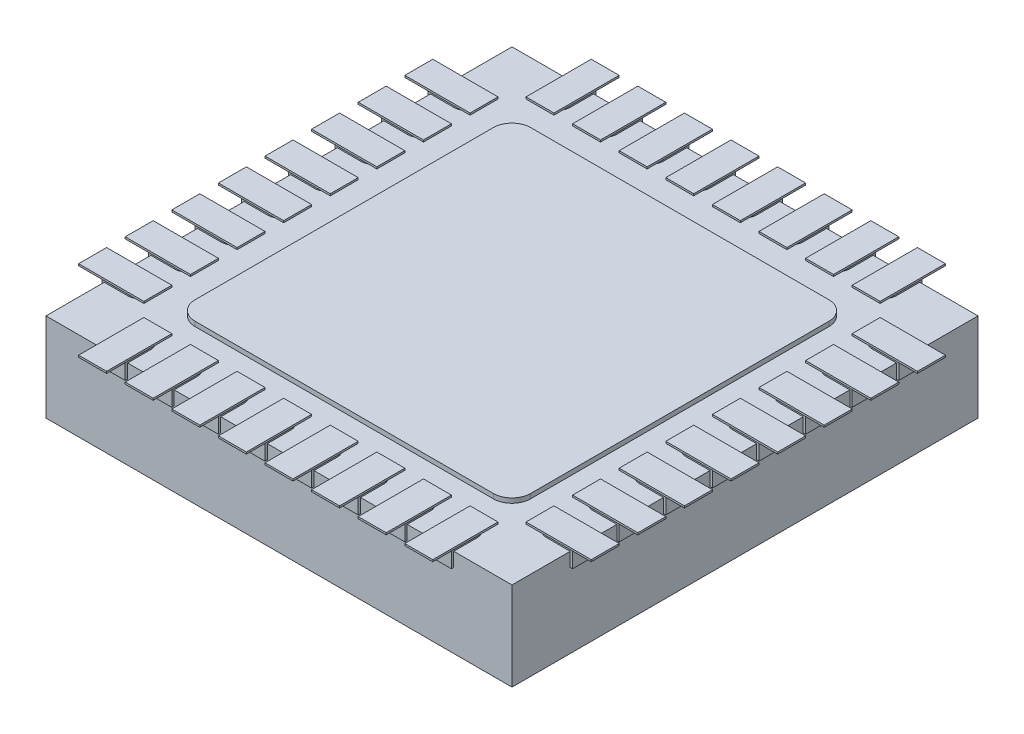
from build123d import *

# Parameters (mm, degrees)
SKETCH3_W                = 5
SKETCH3_H                = 5
BOSS_EXTRUDE2_DEPTH      = 0.95
BOSS_EXTRUDE3_DEPTH      = 0.05
BOSS_EXTRUDE3_DEPTH_BACK = 0.15
SKETCH4_W                = 0.3
SKETCH4_H                = 0.7
SKETCH4_W_2              = 0.7
SKETCH4_H_2              = 0.3
BOSS_EXTRUDE4_DEPTH      = 0.02
CUT_EXTRUDE1_DEPTH       = 0.05
SKETCH7_R                = 0.3
CUT_EXTRUDE3_DEPTH       = 0.1


with BuildPart() as part:
    # Sketch3 → Boss-Extrude2 (new body)
    with BuildSketch(Plane(origin=(0, 0, 0), x_dir=(1, 0, 0), z_dir=(0, 1, 0))):
        Rectangle(SKETCH3_W, SKETCH3_H)
    extrude(amount=-BOSS_EXTRUDE2_DEPTH)

    # Sketch2 → Boss-Extrude3 (add, two sides: drawn at the far end of the back side and taken through both)
    with BuildSketch(Plane(origin=(0, 0, 0), x_dir=(1, 0, 0), z_dir=(0, 1, 0)).offset(-BOSS_EXTRUDE3_DEPTH_BACK)):
        with BuildLine():
            Line((-1.6, -1.8), (1.6, -1.8))
            ThreePointArc((1.6, -1.8), (1.741421356, -1.741421356), (1.8, -1.6))
            Line((1.8, -1.6), (1.8, 1.6))
            ThreePointArc((1.8, 1.6), (1.741421356, 1.741421356), (1.6, 1.8))
            Line((1.6, 1.8), (-1.6, 1.8))
            ThreePointArc((-1.6, 1.8), (-1.741421356, 1.741421356), (-1.8, 1.6))
            Line((-1.8, 1.6), (-1.8, -1.6))
            ThreePointArc((-1.8, -1.6), (-1.741421356, -1.741421356), (-1.6, -1.8))
        make_face()
        with BuildLine():
            Line((-1.875, -2.25), (-1.875, -2.525))
            Line((-1.875, -2.525), (-1.625, -2.525))
            Line((-1.625, -2.525), (-1.625, -2.25))
            ThreePointArc((-1.625, -2.25), (-1.75, -2.125), (-1.875, -2.25))
        make_face()
        with BuildLine():
            Line((-1.875, 2.25), (-1.875, 2.525))
            Line((-1.875, 2.525), (-1.625, 2.525))
            Line((-1.625, 2.525), (-1.625, 2.25))
            ThreePointArc((-1.625, 2.25), (-1.75, 2.125), (-1.875, 2.25))
        make_face()
        with BuildLine():
            Line((-1.375, -2.25), (-1.375, -2.525))
            Line((-1.375, -2.525), (-1.125, -2.525))
            Line((-1.125, -2.525), (-1.125, -2.25))
            ThreePointArc((-1.125, -2.25), (-1.25, -2.125), (-1.375, -2.25))
        make_face()
        with BuildLine():
            Line((-1.125, 2.525), (-1.125, 2.25))
            ThreePointArc((-1.125, 2.25), (-1.25, 2.125), (-1.375, 2.25))
            Line((-1.375, 2.25), (-1.375, 2.525))
            Line((-1.375, 2.525), (-1.125, 2.525))
        make_face()
        with BuildLine():
            Line((-0.875, -2.25), (-0.875, -2.525))
            Line((-0.875, -2.525), (-0.625, -2.525))
            Line((-0.625, -2.525), (-0.625, -2.25))
            ThreePointArc((-0.625, -2.25), (-0.75, -2.125), (-0.875, -2.25))
        make_face()
        with BuildLine():
            Line((-0.625, 2.525), (-0.625, 2.25))
            ThreePointArc((-0.625, 2.25), (-0.75, 2.125), (-0.875, 2.25))
            Line((-0.875, 2.25), (-0.875, 2.525))
            Line((-0.875, 2.525), (-0.625, 2.525))
        make_face()
        with BuildLine():
            Line((-0.375, -2.25), (-0.375, -2.525))
            Line((-0.375, -2.525), (-0.125, -2.525))
            Line((-0.125, -2.525), (-0.125, -2.25))
            ThreePointArc((-0.125, -2.25), (-0.25, -2.125), (-0.375, -2.25))
        make_face()
        with BuildLine():
            Line((-0.125, 2.525), (-0.125, 2.25))
            ThreePointArc((-0.125, 2.25), (-0.25, 2.125), (-0.375, 2.25))
            Line((-0.375, 2.25), (-0.375, 2.525))
            Line((-0.375, 2.525), (-0.125, 2.525))
        make_face()
        with BuildLine():
            Line((0.125, -2.25), (0.125, -2.525))
            Line((0.125, -2.525), (0.375, -2.525))
            Line((0.375, -2.525), (0.375, -2.25))
            ThreePointArc((0.375, -2.25), (0.25, -2.125), (0.125, -2.25))
        make_face()
        with BuildLine():
            Line((0.375, 2.525), (0.375, 2.25))
            ThreePointArc((0.375, 2.25), (0.25, 2.125), (0.125, 2.25))
            Line((0.125, 2.25), (0.125, 2.525))
            Line((0.125, 2.525), (0.375, 2.525))
        make_face()
        with BuildLine():
            Line((0.625, -2.25), (0.625, -2.525))
            Line((0.625, -2.525), (0.875, -2.525))
            Line((0.875, -2.525), (0.875, -2.25))
            ThreePointArc((0.875, -2.25), (0.75, -2.125), (0.625, -2.25))
        make_face()
        with BuildLine():
            Line((0.875, 2.525), (0.875, 2.25))
            ThreePointArc((0.875, 2.25), (0.75, 2.125), (0.625, 2.25))
            Line((0.625, 2.25), (0.625, 2.525))
            Line((0.625, 2.525), (0.875, 2.525))
        make_face()
        with BuildLine():
            Line((1.125, -2.25), (1.125, -2.525))
            Line((1.125, -2.525), (1.375, -2.525))
            Line((1.375, -2.525), (1.375, -2.25))
            ThreePointArc((1.375, -2.25), (1.25, -2.125), (1.125, -2.25))
        make_face()
        with BuildLine():
            Line((1.375, 2.525), (1.375, 2.25))
            ThreePointArc((1.375, 2.25), (1.25, 2.125), (1.125, 2.25))
            Line((1.125, 2.25), (1.125, 2.525))
            Line((1.125, 2.525), (1.375, 2.525))
        make_face()
        with BuildLine():
            Line((1.625, -2.25), (1.625, -2.525))
            Line((1.625, -2.525), (1.875, -2.525))
            Line((1.875, -2.525), (1.875, -2.25))
            ThreePointArc((1.875, -2.25), (1.75, -2.125), (1.625, -2.25))
        make_face()
        with BuildLine():
            Line((1.875, 2.525), (1.875, 2.25))
            ThreePointArc((1.875, 2.25), (1.75, 2.125), (1.625, 2.25))
            Line((1.625, 2.25), (1.625, 2.525))
            Line((1.625, 2.525), (1.875, 2.525))
        make_face()
        with BuildLine():
            Line((-2.525, -1.875), (-2.245, -1.875))
            ThreePointArc((-2.245, -1.875), (-2.12, -1.75), (-2.245, -1.625))
            Line((-2.245, -1.625), (-2.525, -1.625))
            Line((-2.525, -1.625), (-2.525, -1.875))
        make_face()
        with BuildLine():
            Line((2.245, -1.875), (2.525, -1.875))
            Line((2.525, -1.875), (2.525, -1.625))
            Line((2.525, -1.625), (2.245, -1.625))
            ThreePointArc((2.245, -1.625), (2.12, -1.75), (2.245, -1.875))
        make_face()
        with BuildLine():
            Line((-2.245, -1.125), (-2.525, -1.125))
            Line((-2.525, -1.125), (-2.525, -1.375))
            Line((-2.525, -1.375), (-2.245, -1.375))
            ThreePointArc((-2.245, -1.375), (-2.12, -1.25), (-2.245, -1.125))
        make_face()
        with BuildLine():
            Line((2.245, -1.375), (2.525, -1.375))
            Line((2.525, -1.375), (2.525, -1.125))
            Line((2.525, -1.125), (2.245, -1.125))
            ThreePointArc((2.245, -1.125), (2.12, -1.25), (2.245, -1.375))
        make_face()
        with BuildLine():
            Line((-2.245, -0.625), (-2.525, -0.625))
            Line((-2.525, -0.625), (-2.525, -0.875))
            Line((-2.525, -0.875), (-2.245, -0.875))
            ThreePointArc((-2.245, -0.875), (-2.12, -0.75), (-2.245, -0.625))
        make_face()
        with BuildLine():
            Line((2.245, -0.875), (2.525, -0.875))
            Line((2.525, -0.875), (2.525, -0.625))
            Line((2.525, -0.625), (2.245, -0.625))
            ThreePointArc((2.245, -0.625), (2.12, -0.75), (2.245, -0.875))
        make_face()
        with BuildLine():
            Line((-2.245, -0.125), (-2.525, -0.125))
            Line((-2.525, -0.125), (-2.525, -0.375))
            Line((-2.525, -0.375), (-2.245, -0.375))
            ThreePointArc((-2.245, -0.375), (-2.12, -0.25), (-2.245, -0.125))
        make_face()
        with BuildLine():
            Line((2.245, -0.375), (2.525, -0.375))
            Line((2.525, -0.375), (2.525, -0.125))
            Line((2.525, -0.125), (2.245, -0.125))
            ThreePointArc((2.245, -0.125), (2.12, -0.25), (2.245, -0.375))
        make_face()
        with BuildLine():
            Line((-2.245, 0.375), (-2.525, 0.375))
            Line((-2.525, 0.375), (-2.525, 0.125))
            Line((-2.525, 0.125), (-2.245, 0.125))
            ThreePointArc((-2.245, 0.125), (-2.12, 0.25), (-2.245, 0.375))
        make_face()
        with BuildLine():
            Line((2.245, 0.125), (2.525, 0.125))
            Line((2.525, 0.125), (2.525, 0.375))
            Line((2.525, 0.375), (2.245, 0.375))
            ThreePointArc((2.245, 0.375), (2.12, 0.25), (2.245, 0.125))
        make_face()
        with BuildLine():
            Line((-2.245, 0.875), (-2.525, 0.875))
            Line((-2.525, 0.875), (-2.525, 0.625))
            Line((-2.525, 0.625), (-2.245, 0.625))
            ThreePointArc((-2.245, 0.625), (-2.12, 0.75), (-2.245, 0.875))
        make_face()
        with BuildLine():
            Line((2.245, 0.625), (2.525, 0.625))
            Line((2.525, 0.625), (2.525, 0.875))
            Line((2.525, 0.875), (2.245, 0.875))
            ThreePointArc((2.245, 0.875), (2.12, 0.75), (2.245, 0.625))
        make_face()
        with BuildLine():
            Line((-2.245, 1.375), (-2.525, 1.375))
            Line((-2.525, 1.375), (-2.525, 1.125))
            Line((-2.525, 1.125), (-2.245, 1.125))
            ThreePointArc((-2.245, 1.125), (-2.12, 1.25), (-2.245, 1.375))
        make_face()
        with BuildLine():
            Line((2.245, 1.125), (2.525, 1.125))
            Line((2.525, 1.125), (2.525, 1.375))
            Line((2.525, 1.375), (2.245, 1.375))
            ThreePointArc((2.245, 1.375), (2.12, 1.25), (2.245, 1.125))
        make_face()
        with BuildLine():
            Line((-2.245, 1.875), (-2.525, 1.875))
            Line((-2.525, 1.875), (-2.525, 1.625))
            Line((-2.525, 1.625), (-2.245, 1.625))
            ThreePointArc((-2.245, 1.625), (-2.12, 1.75), (-2.245, 1.875))
        make_face()
        with BuildLine():
            Line((2.245, 1.625), (2.525, 1.625))
            Line((2.525, 1.625), (2.525, 1.875))
            Line((2.525, 1.875), (2.245, 1.875))
            ThreePointArc((2.245, 1.875), (2.12, 1.75), (2.245, 1.625))
        make_face()
    extrude(amount=BOSS_EXTRUDE3_DEPTH + BOSS_EXTRUDE3_DEPTH_BACK)

    # Sketch4 → Boss-Extrude4 (add)
    with BuildSketch(Plane(origin=(0, 0.06, 0), x_dir=(1, 0, 0), z_dir=(0, 1, 0))):
        with Locations((-1.75, 2.4)):
            Rectangle(SKETCH4_W, SKETCH4_H)
        with Locations((-1.75, -2.4)):
            Rectangle(SKETCH4_W, SKETCH4_H)
        with Locations((-1.25, -2.4)):
            Rectangle(SKETCH4_W, SKETCH4_H)
        with Locations((-1.25, 2.4)):
            Rectangle(SKETCH4_W, SKETCH4_H)
        with Locations((-0.75, -2.4)):
            Rectangle(SKETCH4_W, SKETCH4_H)
        with Locations((-0.75, 2.4)):
            Rectangle(SKETCH4_W, SKETCH4_H)
        with Locations((-0.25, -2.4)):
            Rectangle(SKETCH4_W, SKETCH4_H)
        with Locations((-0.25, 2.4)):
            Rectangle(SKETCH4_W, SKETCH4_H)
        with Locations((0.25, -2.4)):
            Rectangle(SKETCH4_W, SKETCH4_H)
        with Locations((0.25, 2.4)):
            Rectangle(SKETCH4_W, SKETCH4_H)
        with Locations((0.75, -2.4)):
            Rectangle(SKETCH4_W, SKETCH4_H)
        with Locations((0.75, 2.4)):
            Rectangle(SKETCH4_W, SKETCH4_H)
        with Locations((1.25, -2.4)):
            Rectangle(SKETCH4_W, SKETCH4_H)
        with Locations((1.25, 2.4)):
            Rectangle(SKETCH4_W, SKETCH4_H)
        with Locations((1.75, -2.4)):
            Rectangle(SKETCH4_W, SKETCH4_H)
        with Locations((1.75, 2.4)):
            Rectangle(SKETCH4_W, SKETCH4_H)
        with Locations((-2.4, 1.25)):
            Rectangle(SKETCH4_W_2, SKETCH4_H_2)
        with Locations((-2.4, 1.75)):
            Rectangle(SKETCH4_W_2, SKETCH4_H_2)
        with Locations((2.4, 1.75)):
            Rectangle(SKETCH4_W_2, SKETCH4_H_2)
        with Locations((2.4, 1.25)):
            Rectangle(SKETCH4_W_2, SKETCH4_H_2)
        with Locations((-2.4, 0.75)):
            Rectangle(SKETCH4_W_2, SKETCH4_H_2)
        with Locations((2.4, 0.75)):
            Rectangle(SKETCH4_W_2, SKETCH4_H_2)
        with Locations((-2.4, 0.25)):
            Rectangle(SKETCH4_W_2, SKETCH4_H_2)
        with Locations((2.4, 0.25)):
            Rectangle(SKETCH4_W_2, SKETCH4_H_2)
        with Locations((-2.4, -0.25)):
            Rectangle(SKETCH4_W_2, SKETCH4_H_2)
        with Locations((2.4, -0.25)):
            Rectangle(SKETCH4_W_2, SKETCH4_H_2)
        with Locations((-2.4, -0.75)):
            Rectangle(SKETCH4_W_2, SKETCH4_H_2)
        with Locations((2.4, -0.75)):
            Rectangle(SKETCH4_W_2, SKETCH4_H_2)
        with Locations((-2.4, -1.25)):
            Rectangle(SKETCH4_W_2, SKETCH4_H_2)
        with Locations((2.4, -1.25)):
            Rectangle(SKETCH4_W_2, SKETCH4_H_2)
        with Locations((-2.4, -1.75)):
            Rectangle(SKETCH4_W_2, SKETCH4_H_2)
        with Locations((2.4, -1.75)):
            Rectangle(SKETCH4_W_2, SKETCH4_H_2)
    extrude(amount=-BOSS_EXTRUDE4_DEPTH)

    # Sketch6 → Cut-Extrude1 (cut)
    # profile 1 of 21: a face of its own
    with BuildSketch(Plane.XZ.offset(0.95)):
        with BuildLine():
            Line((0.996865699, -1.50733817), (0.955226935, -1.453422619))
            Line((0.955226935, -1.453422619), (0.934458705, -1.39797247))
            add(Edge.make_bspline(
                [(0.934458705, -1.39797247), (0.934476555, -1.395342211), (0.934506769, -1.390889903), (0.936142397, -1.386768483), (0.936811756, -1.385081845)],
                knots=[0, 0, 0, 0, 1.181526168, 2, 2, 2, 2], degree=3))
            add(Edge.make_bspline(
                [(0.936811756, -1.385081845), (0.937757831, -1.384044334), (0.939606222, -1.382017301), (0.943146034, -1.379791456), (0.947215166, -1.378410533), (0.950134149, -1.378289831), (0.951646205, -1.378227307)],
                knots=[0, 0, 0, 0, 0.991719859, 1.937568686, 2.931644178, 4, 4, 4, 4], degree=3))
            add(Edge.make_bspline(
                [(0.951646205, -1.378227307), (0.952601995, -1.378286269), (0.955238627, -1.378448921), (0.959793689, -1.379099665), (0.965122547, -1.379755149), (0.969550675, -1.380206079), (0.972838204, -1.381044065), (0.974819522, -1.382738398), (0.976487043, -1.385057596), (0.977231144, -1.38693492), (0.977632068, -1.387946429)],
                knots=[0, 0, 0, 0, 0.770051322, 2.124256053, 3.699623575, 5.084597126, 5.717912698, 6.381969714, 7.128199229, 8, 8, 8, 8], degree=3))
            Line((0.977632068, -1.387946429), (0.995433408, -1.434802827))
            Line((0.995433408, -1.434802827), (1.014360119, -1.457105655))
            Line((1.014360119, -1.457105655), (1.048018973, -1.47797619))
            Line((1.048018973, -1.47797619), (1.120247396, -1.47797619))
            Line((1.120247396, -1.47797619), (1.153292411, -1.456594122))
            Line((1.153292411, -1.456594122), (1.190634301, -1.38671875))
            Line((1.190634301, -1.38671875), (1.208333333, -1.317457217))
            Line((1.208333333, -1.317457217), (1.208333333, -1.201953125))
            Line((1.208333333, -1.201953125), (1.189406622, -1.132691592))
            Line((1.189406622, -1.132691592), (1.153292411, -1.066396949))
            Line((1.153292411, -1.066396949), (1.119019717, -1.045833333))
            Line((1.119019717, -1.045833333), (1.047405134, -1.045833333))
            Line((1.047405134, -1.045833333), (1.011904762, -1.066908482))
            Line((1.011904762, -1.066908482), (0.995331101, -1.088085938))
            Line((0.995331101, -1.088085938), (0.975892857, -1.133816964))
            add(Edge.make_bspline(
                [(0.975892857, -1.133816964), (0.974939083, -1.134685262), (0.973044752, -1.136409826), (0.969481565, -1.138159486), (0.965466277, -1.139346241), (0.962568566, -1.139410392), (0.961058408, -1.139443824)],
                knots=[0, 0, 0, 0, 0.944688551, 1.876286096, 2.893214325, 4, 4, 4, 4], degree=3))
            add(Edge.make_bspline(
                [(0.961058408, -1.139443824), (0.959966444, -1.139384056), (0.957197002, -1.139232471), (0.954440947, -1.138918098), (0.952771577, -1.138727679)],
                knots=[0, 0, 0, 0, 0.788580154, 2, 2, 2, 2], degree=3))
            add(Edge.make_bspline(
                [(0.952771577, -1.138727679), (0.951066468, -1.138727679), (0.947724454, -1.138727679), (0.94438244, -1.138727679), (0.942745536, -1.138727679)],
                knots=[0, 0, 0, 0, 1.020408163, 2, 2, 2, 2], degree=3))
            add(Edge.make_bspline(
                [(0.942745536, -1.138727679), (0.941388416, -1.137952053), (0.938782104, -1.136462485), (0.935893733, -1.132957108), (0.934055846, -1.128766975), (0.933916645, -1.125686357), (0.933844866, -1.124097842)],
                knots=[0, 0, 0, 0, 1.027423399, 1.973138154, 2.954852609, 4, 4, 4, 4], degree=3))
            add(Edge.make_bspline(
                [(0.933844866, -1.124097842), (0.933995979, -1.122653084), (0.934341951, -1.119345329), (0.935529221, -1.116233611), (0.936197917, -1.114481027)],
                knots=[0, 0, 0, 0, 0.873557982, 2, 2, 2, 2], degree=3))
            Line((0.936197917, -1.114481027), (0.955840774, -1.06609003))
            Line((0.955840774, -1.06609003), (1.000446429, -1.012583705))
            Line((1.000446429, -1.012583705), (1.041982887, -0.986904762))
            Line((1.041982887, -0.986904762), (1.127613467, -0.986904762))
            Line((1.127613467, -0.986904762), (1.171605283, -1.01452753))
            Line((1.171605283, -1.01452753), (1.21375558, -1.068340774))
            Line((1.21375558, -1.068340774), (1.235137649, -1.124404762))
            Line((1.235137649, -1.124404762), (1.254166667, -1.19765625))
            Line((1.254166667, -1.19765625), (1.254166667, -1.327687872))
            Line((1.254166667, -1.327687872), (1.232784598, -1.406156994))
            Line((1.232784598, -1.406156994), (1.212527902, -1.456184896))
            Line((1.212527902, -1.456184896), (1.168638393, -1.50999814))
            Line((1.168638393, -1.50999814), (1.127613467, -1.536188616))
            Line((1.127613467, -1.536188616), (1.124646577, -1.536904762))
            Line((1.124646577, -1.536904762), (1.040857515, -1.536188616))
            Line((1.040857515, -1.536188616), (0.996865699, -1.50733817))
        make_face()
    # profile 2 of 21: a face of its own
    with BuildSketch(Plane.XZ.offset(0.95)):
        with BuildLine():
            Line((0.584365699, -1.50733817), (0.542726935, -1.453422619))
            Line((0.542726935, -1.453422619), (0.521958705, -1.39797247))
            add(Edge.make_bspline(
                [(0.521958705, -1.39797247), (0.521976555, -1.395342211), (0.522006769, -1.390889903), (0.523642397, -1.386768483), (0.524311756, -1.385081845)],
                knots=[0, 0, 0, 0, 1.181526168, 2, 2, 2, 2], degree=3))
            add(Edge.make_bspline(
                [(0.524311756, -1.385081845), (0.525257831, -1.384044334), (0.527106222, -1.382017301), (0.530646034, -1.379791456), (0.534715166, -1.378410533), (0.537634149, -1.378289831), (0.539146205, -1.378227307)],
                knots=[0, 0, 0, 0, 0.991719859, 1.937568686, 2.931644178, 4, 4, 4, 4], degree=3))
            add(Edge.make_bspline(
                [(0.539146205, -1.378227307), (0.540101995, -1.378286269), (0.542738627, -1.378448921), (0.547293689, -1.379099665), (0.552622547, -1.379755149), (0.557050675, -1.380206079), (0.560338204, -1.381044065), (0.562319522, -1.382738398), (0.563987043, -1.385057596), (0.564731144, -1.38693492), (0.565132068, -1.387946429)],
                knots=[0, 0, 0, 0, 0.770051322, 2.124256053, 3.699623575, 5.084597126, 5.717912698, 6.381969714, 7.128199229, 8, 8, 8, 8], degree=3))
            Line((0.565132068, -1.387946429), (0.582933408, -1.434802827))
            Line((0.582933408, -1.434802827), (0.601860119, -1.457105655))
            Line((0.601860119, -1.457105655), (0.635518973, -1.47797619))
            Line((0.635518973, -1.47797619), (0.707747396, -1.47797619))
            Line((0.707747396, -1.47797619), (0.740792411, -1.456594122))
            Line((0.740792411, -1.456594122), (0.778134301, -1.38671875))
            Line((0.778134301, -1.38671875), (0.795833333, -1.317457217))
            Line((0.795833333, -1.317457217), (0.795833333, -1.201953125))
            Line((0.795833333, -1.201953125), (0.776906622, -1.132691592))
            Line((0.776906622, -1.132691592), (0.740792411, -1.066396949))
            Line((0.740792411, -1.066396949), (0.706519717, -1.045833333))
            Line((0.706519717, -1.045833333), (0.634905134, -1.045833333))
            Line((0.634905134, -1.045833333), (0.599404762, -1.066908482))
            Line((0.599404762, -1.066908482), (0.582831101, -1.088085938))
            Line((0.582831101, -1.088085938), (0.563392857, -1.133816964))
            add(Edge.make_bspline(
                [(0.563392857, -1.133816964), (0.562439083, -1.134685262), (0.560544752, -1.136409826), (0.556981565, -1.138159486), (0.552966277, -1.139346241), (0.550068566, -1.139410392), (0.548558408, -1.139443824)],
                knots=[0, 0, 0, 0, 0.944688551, 1.876286096, 2.893214325, 4, 4, 4, 4], degree=3))
            add(Edge.make_bspline(
                [(0.548558408, -1.139443824), (0.547466444, -1.139384056), (0.544697002, -1.139232471), (0.541940947, -1.138918098), (0.540271577, -1.138727679)],
                knots=[0, 0, 0, 0, 0.788580154, 2, 2, 2, 2], degree=3))
            add(Edge.make_bspline(
                [(0.540271577, -1.138727679), (0.538566468, -1.138727679), (0.535224454, -1.138727679), (0.53188244, -1.138727679), (0.530245536, -1.138727679)],
                knots=[0, 0, 0, 0, 1.020408163, 2, 2, 2, 2], degree=3))
            add(Edge.make_bspline(
                [(0.530245536, -1.138727679), (0.528888416, -1.137952053), (0.526282104, -1.136462485), (0.523393733, -1.132957108), (0.521555846, -1.128766975), (0.521416645, -1.125686357), (0.521344866, -1.124097842)],
                knots=[0, 0, 0, 0, 1.027423399, 1.973138154, 2.954852609, 4, 4, 4, 4], degree=3))
            add(Edge.make_bspline(
                [(0.521344866, -1.124097842), (0.521495979, -1.122653084), (0.521841951, -1.119345329), (0.523029221, -1.116233611), (0.523697917, -1.114481027)],
                knots=[0, 0, 0, 0, 0.873557982, 2, 2, 2, 2], degree=3))
            Line((0.523697917, -1.114481027), (0.543340774, -1.06609003))
            Line((0.543340774, -1.06609003), (0.587946429, -1.012583705))
            Line((0.587946429, -1.012583705), (0.629482887, -0.986904762))
            Line((0.629482887, -0.986904762), (0.715113467, -0.986904762))
            Line((0.715113467, -0.986904762), (0.759105283, -1.01452753))
            Line((0.759105283, -1.01452753), (0.80125558, -1.068340774))
            Line((0.80125558, -1.068340774), (0.822637649, -1.124404762))
            Line((0.822637649, -1.124404762), (0.841666667, -1.19765625))
            Line((0.841666667, -1.19765625), (0.841666667, -1.327687872))
            Line((0.841666667, -1.327687872), (0.820284598, -1.406156994))
            Line((0.820284598, -1.406156994), (0.800027902, -1.456184896))
            Line((0.800027902, -1.456184896), (0.756138393, -1.50999814))
            Line((0.756138393, -1.50999814), (0.715113467, -1.536188616))
            Line((0.715113467, -1.536188616), (0.712146577, -1.536904762))
            Line((0.712146577, -1.536904762), (0.628357515, -1.536188616))
            Line((0.628357515, -1.536188616), (0.584365699, -1.50733817))
        make_face()
    # profile 3 of 21: a face of its own
    with BuildSketch(Plane.XZ.offset(0.95)):
        with BuildLine():
            Line((0.191201637, -1.507952009), (0.168489583, -1.479817708))
            Line((0.168489583, -1.479817708), (0.147619048, -1.42641369))
            Line((0.147619048, -1.42641369), (0.147619048, -1.371475074))
            Line((0.147619048, -1.371475074), (0.148846726, -1.365541295))
            Line((0.148846726, -1.365541295), (0.169717262, -1.315104167))
            Line((0.169717262, -1.315104167), (0.209719122, -1.24093192))
            Line((0.209719122, -1.24093192), (0.351311384, -1.045833333))
            Line((0.351311384, -1.045833333), (0.136774554, -1.045833333))
            add(Edge.make_bspline(
                [(0.136774554, -1.045833333), (0.135508617, -1.044880394), (0.132886157, -1.042906325), (0.130185821, -1.038311992), (0.128717947, -1.03248841), (0.128568899, -1.028212402), (0.128487723, -1.025883557)],
                knots=[0, 0, 0, 0, 0.835533444, 1.730855502, 2.764154603, 4, 4, 4, 4], degree=3))
            add(Edge.make_bspline(
                [(0.128487723, -1.025883557), (0.128552384, -1.024757941), (0.128719049, -1.021856646), (0.128956336, -1.018960207), (0.129101562, -1.0171875)],
                knots=[0, 0, 0, 0, 0.775940213, 2, 2, 2, 2], degree=3))
            add(Edge.make_bspline(
                [(0.129101562, -1.0171875), (0.129257378, -1.014868497), (0.129562149, -1.010332597), (0.12925277, -1.005797321), (0.129101562, -1.003580729)],
                knots=[0, 0, 0, 0, 1.022510555, 2, 2, 2, 2], degree=3))
            add(Edge.make_bspline(
                [(0.129101562, -1.003580729), (0.129173751, -1.001968052), (0.129309428, -0.998937061), (0.130479864, -0.994740851), (0.132241008, -0.991119668), (0.13412412, -0.989382344), (0.135035342, -0.988541667)],
                knots=[0, 0, 0, 0, 1.156160642, 2.172979539, 3.115919479, 4, 4, 4, 4], degree=3))
            Line((0.135035342, -0.988541667), (0.138616071, -0.986904762))
            Line((0.138616071, -0.986904762), (0.420265997, -0.986904762))
            add(Edge.make_bspline(
                [(0.420265997, -0.986904762), (0.421486589, -0.987393854), (0.423912472, -0.988365907), (0.426622643, -0.991624863), (0.428424875, -0.995919036), (0.428905987, -0.999229413), (0.429166667, -1.001023065)],
                knots=[0, 0, 0, 0, 0.877497478, 1.743995249, 2.777634855, 4, 4, 4, 4], degree=3))
            add(Edge.make_bspline(
                [(0.429166667, -1.001023065), (0.429033241, -1.003358572), (0.428777957, -1.00782712), (0.426617312, -1.011739306), (0.425585937, -1.013606771)],
                knots=[0, 0, 0, 0, 1.045308762, 2, 2, 2, 2], degree=3))
            Line((0.425585937, -1.013606771), (0.247470238, -1.261393229))
            add(Edge.make_bspline(
                [(0.247470238, -1.261393229), (0.242525422, -1.270532614), (0.232635789, -1.288811384), (0.222746156, -1.307090154), (0.217801339, -1.316229539)],
                knots=[0, 0, 0, 0, 1, 2, 2, 2, 2], degree=3))
            add(Edge.make_bspline(
                [(0.217801339, -1.316229539), (0.215086488, -1.321591965), (0.209895213, -1.331845871), (0.203312845, -1.346957625), (0.197624417, -1.360803849), (0.194792871, -1.369851684), (0.193452381, -1.374135045)],
                knots=[0, 0, 0, 0, 1.146390494, 2.192101283, 3.14411757, 4, 4, 4, 4], degree=3))
            Line((0.193452381, -1.374135045), (0.193452381, -1.416387649))
            Line((0.193452381, -1.416387649), (0.210026042, -1.457924107))
            Line((0.210026042, -1.457924107), (0.24327567, -1.47797619))
            Line((0.24327567, -1.47797619), (0.315708705, -1.47797619))
            Line((0.315708705, -1.47797619), (0.348958333, -1.456389509))
            Line((0.348958333, -1.456389509), (0.364406622, -1.414648438))
            Line((0.364406622, -1.414648438), (0.364406622, -1.397563244))
            add(Edge.make_bspline(
                [(0.364406622, -1.397563244), (0.364490805, -1.395503234), (0.36464624, -1.391699606), (0.366107529, -1.386546598), (0.368381621, -1.382242218), (0.370871865, -1.38050307), (0.372079613, -1.379659598)],
                knots=[0, 0, 0, 0, 1.209701834, 2.233608353, 3.143314783, 4, 4, 4, 4], degree=3))
            add(Edge.make_bspline(
                [(0.372079613, -1.379659598), (0.373783064, -1.379463512), (0.377758822, -1.379005859), (0.381761682, -1.378966149), (0.384049479, -1.378943452)],
                knots=[0, 0, 0, 0, 0.856918679, 2, 2, 2, 2], degree=3))
            add(Edge.make_bspline(
                [(0.384049479, -1.378943452), (0.387325848, -1.378958631), (0.392860684, -1.378984271), (0.398373612, -1.379463891), (0.40062314, -1.379659598)],
                knots=[0, 0, 0, 0, 1.183907999, 2, 2, 2, 2], degree=3))
            add(Edge.make_bspline(
                [(0.40062314, -1.379659598), (0.402106669, -1.380330036), (0.405098691, -1.381682192), (0.408233702, -1.386089389), (0.409836973, -1.39192498), (0.410031003, -1.396289641), (0.410137649, -1.398688616)],
                knots=[0, 0, 0, 0, 0.844617517, 1.703447207, 2.737732144, 4, 4, 4, 4], degree=3))
            add(Edge.make_bspline(
                [(0.410137649, -1.398688616), (0.41026659, -1.399642795), (0.41064317, -1.402429524), (0.410338198, -1.405233718), (0.410137649, -1.407077753)],
                knots=[0, 0, 0, 0, 0.68480177, 2, 2, 2, 2], degree=3))
            add(Edge.make_bspline(
                [(0.410137649, -1.407077753), (0.409984076, -1.409327721), (0.409674819, -1.413858579), (0.409574375, -1.41839888), (0.40952381, -1.420684524)],
                knots=[0, 0, 0, 0, 0.993175091, 2, 2, 2, 2], degree=3))
            Line((0.40952381, -1.420684524), (0.408398437, -1.427539062))
            Line((0.408398437, -1.427539062), (0.388039435, -1.479203869))
            Line((0.388039435, -1.479203869), (0.36297433, -1.51030506))
            add(Edge.make_bspline(
                [(0.36297433, -1.51030506), (0.36029208, -1.512029456), (0.354303469, -1.515879484), (0.344095801, -1.521776191), (0.332220169, -1.529151078), (0.323532543, -1.534200651), (0.318880208, -1.536904762)],
                knots=[0, 0, 0, 0, 0.742919736, 1.658703783, 2.746206184, 4, 4, 4, 4], degree=3))
            Line((0.318880208, -1.536904762), (0.235295759, -1.536188616))
            Line((0.235295759, -1.536188616), (0.191201637, -1.507952009))
        make_face()
    # profile 4 of 21: a face of its own
    with BuildSketch(Plane.XZ.offset(0.95)):
        with BuildLine():
            add(Edge.make_bspline(
                [(-0.215057664, -1.53608631), (-0.215897702, -1.536021592), (-0.217513602, -1.535897102), (-0.219666208, -1.534457651), (-0.221270896, -1.532251799), (-0.222403702, -1.529211973), (-0.222973724, -1.525388257), (-0.22366402, -1.520796182), (-0.223893989, -1.51535387), (-0.223935915, -1.511464198), (-0.223958333, -1.509384301)],
                knots=[0, 0, 0, 0, 0.647888903, 1.24628035, 1.949281567, 2.750339596, 3.753055269, 4.961922719, 6.375469489, 8, 8, 8, 8], degree=3))
            Line((-0.223958333, -1.509384301), (-0.223958333, -1.490559896))
            add(Edge.make_bspline(
                [(-0.223958333, -1.490559896), (-0.223269208, -1.488346871), (-0.221958407, -1.484137422), (-0.218873703, -1.480999173), (-0.217410714, -1.479510789)],
                knots=[0, 0, 0, 0, 1.05145589, 2, 2, 2, 2], degree=3))
            Line((-0.217410714, -1.479510789), (-0.211476935, -1.47797619))
            Line((-0.211476935, -1.47797619), (-0.045638021, -1.47797619))
            Line((-0.045638021, -1.47797619), (-0.044410342, -1.472758557))
            Line((-0.044410342, -1.472758557), (-0.030189732, -1.343852307))
            add(Edge.make_bspline(
                [(-0.030189732, -1.343852307), (-0.0328798, -1.344919923), (-0.038819837, -1.347277366), (-0.04871867, -1.350915373), (-0.060352779, -1.355356977), (-0.068755899, -1.358457087), (-0.073260789, -1.360119048)],
                knots=[0, 0, 0, 0, 0.754295024, 1.66558661, 2.748527582, 4, 4, 4, 4], degree=3))
            Line((-0.073260789, -1.360119048), (-0.137406994, -1.359402902))
            Line((-0.137406994, -1.359402902), (-0.198995536, -1.334235491))
            add(Edge.make_bspline(
                [(-0.198995536, -1.334235491), (-0.206564129, -1.325087933), (-0.221727841, -1.306760758), (-0.23650607, -1.288121349), (-0.24390811, -1.278785342)],
                knots=[0, 0, 0, 0, 0.998250801, 2, 2, 2, 2], degree=3))
            Line((-0.24390811, -1.278785342), (-0.264880952, -1.199702381))
            Line((-0.264880952, -1.199702381), (-0.264880952, -1.146502976))
            Line((-0.264880952, -1.146502976), (-0.244010417, -1.068238467))
            add(Edge.make_bspline(
                [(-0.244010417, -1.068238467), (-0.236608377, -1.058902461), (-0.221830147, -1.040263052), (-0.206666436, -1.021935877), (-0.199097842, -1.012788318)],
                knots=[0, 0, 0, 0, 1.001749199, 2, 2, 2, 2], degree=3))
            Line((-0.199097842, -1.012788318), (-0.134644717, -0.986904762))
            Line((-0.134644717, -0.986904762), (-0.070703125, -0.986904762))
            Line((-0.070703125, -0.986904762), (-0.009114583, -1.013197545))
            Line((-0.009114583, -1.013197545), (0.014825149, -1.041024926))
            Line((0.014825149, -1.041024926), (0.036309524, -1.095145089))
            add(Edge.make_bspline(
                [(0.036309524, -1.095145089), (0.036247004, -1.096712119), (0.036129898, -1.099647288), (0.03588477, -1.103738147), (0.03487763, -1.107036991), (0.033820735, -1.109768163), (0.032095367, -1.111860432), (0.02966053, -1.113222456), (0.026638612, -1.114007978), (0.02441312, -1.114115947), (0.023214286, -1.114174107)],
                knots=[0, 0, 0, 0, 1.403751092, 2.629334449, 3.642786757, 4.475492558, 5.232786981, 6.011861082, 6.929023956, 8, 8, 8, 8], degree=3))
            add(Edge.make_bspline(
                [(0.023214286, -1.114174107), (0.022903985, -1.114116394), (0.022081038, -1.113963333), (0.021329437, -1.113588902), (0.020861235, -1.113355655)],
                knots=[0, 0, 0, 0, 0.754121326, 2, 2, 2, 2], degree=3))
            add(Edge.make_bspline(
                [(0.020861235, -1.113355655), (0.020247396, -1.113355655), (0.019019717, -1.113355655), (0.017075893, -1.113355655), (0.01468874, -1.113355655), (0.012915427, -1.113355655), (0.011858259, -1.113355655)],
                knots=[0, 0, 0, 0, 0.818181818, 1.636363636, 2.590909091, 4, 4, 4, 4], degree=3))
            add(Edge.make_bspline(
                [(0.011858259, -1.113355655), (0.010839832, -1.113592251), (0.009086042, -1.113999684), (0.007290985, -1.114122578), (0.006538318, -1.114174107)],
                knots=[0, 0, 0, 0, 1.161401177, 2, 2, 2, 2], degree=3))
            add(Edge.make_bspline(
                [(0.006538318, -1.114174107), (0.004987586, -1.11409546), (0.002101105, -1.113949069), (-0.00185033, -1.11234856), (-0.004869554, -1.109570144), (-0.005986759, -1.107131717), (-0.00655692, -1.105887277)],
                knots=[0, 0, 0, 0, 1.115803358, 2.076918325, 3.01856323, 4, 4, 4, 4], degree=3))
            Line((-0.00655692, -1.105887277), (-0.020265997, -1.075502232))
            add(Edge.make_bspline(
                [(-0.020265997, -1.075502232), (-0.022092226, -1.073605331), (-0.025761819, -1.069793731), (-0.03224138, -1.065025372), (-0.039272081, -1.060731172), (-0.049664104, -1.056523081), (-0.062612231, -1.051649045), (-0.072919637, -1.047745025), (-0.07796689, -1.045833333)],
                knots=[0, 0, 0, 0, 0.721307101, 1.449381514, 2.200486754, 2.975859805, 4.519161852, 6, 6, 6, 6], degree=3))
            Line((-0.07796689, -1.045833333), (-0.13218936, -1.045833333))
            Line((-0.13218936, -1.045833333), (-0.167894345, -1.060974702))
            Line((-0.167894345, -1.060974702), (-0.190504092, -1.079594494))
            Line((-0.190504092, -1.079594494), (-0.207691592, -1.111309524))
            Line((-0.207691592, -1.111309524), (-0.219047619, -1.154482887))
            Line((-0.219047619, -1.154482887), (-0.219047619, -1.196121652))
            Line((-0.219047619, -1.196121652), (-0.207077753, -1.239295015))
            Line((-0.207077753, -1.239295015), (-0.191629464, -1.26671317))
            Line((-0.191629464, -1.26671317), (-0.165336682, -1.287481399))
            Line((-0.165336682, -1.287481399), (-0.12952939, -1.301190476))
            Line((-0.12952939, -1.301190476), (-0.057300967, -1.301190476))
            Line((-0.057300967, -1.301190476), (-0.018526786, -1.280422247))
            Line((-0.018526786, -1.280422247), (0.008891369, -1.280422247))
            add(Edge.make_bspline(
                [(0.008891369, -1.280422247), (0.00999361, -1.28115244), (0.012255412, -1.282650799), (0.014908159, -1.286071661), (0.016455532, -1.29055254), (0.016992536, -1.293814424), (0.017280506, -1.295563616)],
                knots=[0, 0, 0, 0, 0.876667075, 1.798923925, 2.81966889, 4, 4, 4, 4], degree=3))
            Line((0.017280506, -1.295563616), (-0.003487723, -1.527083333))
            add(Edge.make_bspline(
                [(-0.003487723, -1.527083333), (-0.00367563, -1.528337453), (-0.004030444, -1.530705533), (-0.005888463, -1.533773073), (-0.008763529, -1.535982505), (-0.011122914, -1.536582792), (-0.012388393, -1.536904762)],
                knots=[0, 0, 0, 0, 1.050775388, 1.984116291, 2.918761046, 4, 4, 4, 4], degree=3))
            Line((-0.012388393, -1.536904762), (-0.215057664, -1.53608631))
        make_face()
    # profile 5 of 21: a face of its own
    with BuildSketch(Plane.XZ.offset(0.95)):
        with BuildLine():
            add(Edge.make_bspline(
                [(-0.595228795, -1.53311942), (-0.596260283, -1.530939754), (-0.598404752, -1.526408219), (-0.598671224, -1.521397217), (-0.598809524, -1.518796503)],
                knots=[0, 0, 0, 0, 0.961998562, 2, 2, 2, 2], degree=3))
            Line((-0.598809524, -1.518796503), (-0.598809524, -1.163690476))
            Line((-0.598809524, -1.163690476), (-0.667457217, -1.163690476))
            add(Edge.make_bspline(
                [(-0.667457217, -1.163690476), (-0.669353334, -1.162593301), (-0.672872254, -1.160557102), (-0.674417565, -1.1568201), (-0.675130208, -1.155096726)],
                knots=[0, 0, 0, 0, 1.077669981, 2, 2, 2, 2], degree=3))
            add(Edge.make_bspline(
                [(-0.675130208, -1.155096726), (-0.675649158, -1.151931905), (-0.676759843, -1.14515838), (-0.676831333, -1.138293037), (-0.67686942, -1.134635417)],
                knots=[0, 0, 0, 0, 0.934468093, 2, 2, 2, 2], degree=3))
            add(Edge.make_bspline(
                [(-0.67686942, -1.134635417), (-0.676807996, -1.133305002), (-0.676662971, -1.130163825), (-0.67640455, -1.127029834), (-0.67625558, -1.125223214)],
                knots=[0, 0, 0, 0, 0.847080496, 2, 2, 2, 2], degree=3))
            add(Edge.make_bspline(
                [(-0.67625558, -1.125223214), (-0.676087001, -1.123585697), (-0.675788302, -1.120684251), (-0.676113791, -1.117788574), (-0.67625558, -1.116527158)],
                knots=[0, 0, 0, 0, 1.128759324, 2, 2, 2, 2], degree=3))
            add(Edge.make_bspline(
                [(-0.67625558, -1.116527158), (-0.675511751, -1.114200583), (-0.674225819, -1.110178403), (-0.671047729, -1.107447678), (-0.669707961, -1.106296503)],
                knots=[0, 0, 0, 0, 1.15687269, 2, 2, 2, 2], degree=3))
            Line((-0.669707961, -1.106296503), (-0.66264881, -1.104761905))
            Line((-0.66264881, -1.104761905), (-0.598809524, -1.104761905))
            Line((-0.598809524, -1.104761905), (-0.598809524, -0.996930804))
            add(Edge.make_bspline(
                [(-0.598809524, -0.996930804), (-0.597972703, -0.99474151), (-0.596420033, -0.990679408), (-0.59294383, -0.988095882), (-0.591341146, -0.986904762)],
                knots=[0, 0, 0, 0, 1.077911376, 2, 2, 2, 2], degree=3))
            Line((-0.591341146, -0.986904762), (-0.561672247, -0.986904762))
            add(Edge.make_bspline(
                [(-0.561672247, -0.986904762), (-0.560068642, -0.987655859), (-0.556576773, -0.989291382), (-0.555036687, -0.992855197), (-0.554203869, -0.994782366)],
                knots=[0, 0, 0, 0, 0.918479413, 2, 2, 2, 2], degree=3))
            Line((-0.554203869, -0.994782366), (-0.55297619, -1.000511533))
            Line((-0.55297619, -1.000511533), (-0.55297619, -1.104761905))
            Line((-0.55297619, -1.104761905), (-0.365448289, -1.104761905))
            add(Edge.make_bspline(
                [(-0.365448289, -1.104761905), (-0.364224014, -1.105134395), (-0.361774559, -1.105879651), (-0.359127473, -1.109056066), (-0.357231062, -1.113237786), (-0.356792021, -1.11653385), (-0.356547619, -1.118368676)],
                knots=[0, 0, 0, 0, 0.862857035, 1.726352042, 2.734324542, 4, 4, 4, 4], degree=3))
            Line((-0.356547619, -1.118368676), (-0.357775298, -1.127473958))
            Line((-0.357775298, -1.127473958), (-0.577325149, -1.53311942))
            add(Edge.make_bspline(
                [(-0.577325149, -1.53311942), (-0.578444324, -1.534235669), (-0.580758383, -1.536543679), (-0.584026675, -1.536781804), (-0.585714286, -1.536904762)],
                knots=[0, 0, 0, 0, 0.967282998, 2, 2, 2, 2], degree=3))
            add(Edge.make_bspline(
                [(-0.585714286, -1.536904762), (-0.587561573, -1.536780249), (-0.591146784, -1.536538595), (-0.59389608, -1.534235729), (-0.595228795, -1.53311942)],
                knots=[0, 0, 0, 0, 1.030504549, 2, 2, 2, 2], degree=3))
        make_face()
        Polygon((-0.426627604, -1.163690476), (-0.55297619, -1.163690476), (-0.55297619, -1.393061756), align=None, mode=Mode.SUBTRACT)
    # profile 6 of 21: a face of its own
    with BuildSketch(Plane.XZ.offset(0.95)):
        Polygon((-0.985425967, -1.50999814), (-0.989620536, -1.504780506), (-1.030236235, -1.428562128), (-1.050595238, -1.296995908), (-1.050595238, -1.22077753), (-1.029724702, -1.09453125), (-0.987983631, -1.015345982), (-0.982561384, -1.01156064), (-0.921177455, -0.986904762), (-0.876469494, -0.986904762), (-0.814983259, -1.013095238), (-0.810277158, -1.018312872), (-0.770275298, -1.093917411), (-0.749404762, -1.225585938), (-0.749404762, -1.304975818), (-0.769763765, -1.429175967), (-0.812732515, -1.508463542), (-0.816927083, -1.512248884), (-0.879640997, -1.536904762), (-0.923325893, -1.536188616), align=None)
        Polygon((-0.961588542, -1.459458705), (-0.918312872, -1.47797619), (-0.881687128, -1.47797619), (-0.838411458, -1.459458705), (-0.814778646, -1.415876116), (-0.795238095, -1.298428199), (-0.795238095, -1.230496652), (-0.814778646, -1.109365699), (-0.839025298, -1.064350818), (-0.881687128, -1.045833333), (-0.916573661, -1.045833333), (-0.962100074, -1.063532366), (-0.986449033, -1.108649554), (-1.004761905, -1.223846726), (-1.004761905, -1.292596726), (-0.985835193, -1.414443824), align=None, mode=Mode.SUBTRACT)
    # profile 7 of 21: a face of its own
    with BuildSketch(Plane.XZ.offset(0.95)):
        with BuildLine():
            add(Edge.make_bspline(
                [(0.981928943, -0.63608631), (0.981195132, -0.63600872), (0.979718729, -0.635852613), (0.977716398, -0.634471449), (0.976358957, -0.632181832), (0.974715306, -0.627891389), (0.973835229, -0.620663372), (0.973711713, -0.614496288), (0.973642113, -0.611021205)],
                knots=[0, 0, 0, 0, 0.458930941, 0.92335228, 1.465177174, 2.111000206, 3.808592728, 6, 6, 6, 6], degree=3))
            Line((0.973642113, -0.611021205), (0.973642113, -0.590559896))
            add(Edge.make_bspline(
                [(0.973642113, -0.590559896), (0.974300361, -0.588157467), (0.975516375, -0.583719338), (0.979070872, -0.58083417), (0.980701265, -0.579510789)],
                knots=[0, 0, 0, 0, 1.082630928, 2, 2, 2, 2], degree=3))
            Line((0.980701265, -0.579510789), (0.986635045, -0.57797619))
            Line((0.986635045, -0.57797619), (1.188690476, -0.57797619))
            Line((1.188690476, -0.57797619), (1.188690476, -0.388095238))
            Line((1.188690476, -0.388095238), (1.080552455, -0.388095238))
            add(Edge.make_bspline(
                [(1.080552455, -0.388095238), (1.079839356, -0.387874012), (1.078259822, -0.38738399), (1.076412701, -0.385327923), (1.074473406, -0.382693276), (1.073452264, -0.380517407), (1.072879464, -0.379296875)],
                knots=[0, 0, 0, 0, 0.730957828, 1.619092074, 2.664453419, 4, 4, 4, 4], degree=3))
            add(Edge.make_bspline(
                [(1.072879464, -0.379296875), (1.072689776, -0.378105415), (1.072268823, -0.37546135), (1.072043434, -0.371079756), (1.071819329, -0.365931207), (1.071776881, -0.36224623), (1.071754092, -0.360267857)],
                knots=[0, 0, 0, 0, 0.758257029, 1.682708873, 2.755903774, 4, 4, 4, 4], degree=3))
            add(Edge.make_bspline(
                [(1.071754092, -0.360267857), (1.071749575, -0.357948875), (1.07174127, -0.353685742), (1.071791978, -0.347920999), (1.072084632, -0.343350147), (1.072122314, -0.338942878), (1.073843042, -0.334012325), (1.077100623, -0.331909237), (1.078813244, -0.330803571)],
                knots=[0, 0, 0, 0, 1.303816242, 2.396889211, 3.2414061, 3.875301435, 4.882973714, 6, 6, 6, 6], degree=3))
            Line((1.078813244, -0.330803571), (1.084644717, -0.329166667))
            Line((1.084644717, -0.329166667), (1.188690476, -0.329166667))
            Line((1.188690476, -0.329166667), (1.188690476, -0.098567708))
            add(Edge.make_bspline(
                [(1.188690476, -0.098567708), (1.188911838, -0.097461136), (1.189337306, -0.095334245), (1.190744125, -0.092568924), (1.19272238, -0.090469048), (1.196300874, -0.088375148), (1.202563841, -0.087069381), (1.207922869, -0.086964725), (1.210993304, -0.086904762)],
                knots=[0, 0, 0, 0, 0.722765208, 1.389193855, 1.962686797, 2.552686501, 4.024875501, 6, 6, 6, 6], degree=3))
            Line((1.210993304, -0.086904762), (1.226441592, -0.086904762))
            add(Edge.make_bspline(
                [(1.226441592, -0.086904762), (1.228061618, -0.087994879), (1.231683157, -0.090431816), (1.233512686, -0.094419831), (1.23452381, -0.096623884)],
                knots=[0, 0, 0, 0, 0.894661657, 2, 2, 2, 2], degree=3))
            Line((1.23452381, -0.096623884), (1.23452381, -0.109309896))
            Line((1.23452381, -0.109309896), (1.23452381, -0.625651042))
            add(Edge.make_bspline(
                [(1.23452381, -0.625651042), (1.234182813, -0.626940661), (1.233518402, -0.629453405), (1.23138982, -0.632695665), (1.22852031, -0.635267652), (1.22620392, -0.636347736), (1.225009301, -0.636904762)],
                knots=[0, 0, 0, 0, 1.034608711, 2.015872402, 2.976736403, 4, 4, 4, 4], degree=3))
            Line((1.225009301, -0.636904762), (0.981928943, -0.63608631))
        make_face()
    # profile 8 of 21: a face of its own
    with BuildSketch(Plane.XZ.offset(0.95)):
        with BuildLine():
            Line((0.662630208, -0.607952009), (0.639918155, -0.579817708))
            Line((0.639918155, -0.579817708), (0.619047619, -0.52641369))
            Line((0.619047619, -0.52641369), (0.619047619, -0.471475074))
            Line((0.619047619, -0.471475074), (0.620275298, -0.465541295))
            Line((0.620275298, -0.465541295), (0.641145833, -0.415104167))
            Line((0.641145833, -0.415104167), (0.681147693, -0.34093192))
            Line((0.681147693, -0.34093192), (0.822739955, -0.145833333))
            Line((0.822739955, -0.145833333), (0.608203125, -0.145833333))
            add(Edge.make_bspline(
                [(0.608203125, -0.145833333), (0.606937189, -0.144880394), (0.604314729, -0.142906325), (0.601614393, -0.138311992), (0.600146519, -0.13248841), (0.599997471, -0.128212402), (0.599916295, -0.125883557)],
                knots=[0, 0, 0, 0, 0.835533444, 1.730855502, 2.764154603, 4, 4, 4, 4], degree=3))
            add(Edge.make_bspline(
                [(0.599916295, -0.125883557), (0.599980956, -0.124757941), (0.600147621, -0.121856646), (0.600384907, -0.118960207), (0.600530134, -0.1171875)],
                knots=[0, 0, 0, 0, 0.775940213, 2, 2, 2, 2], degree=3))
            add(Edge.make_bspline(
                [(0.600530134, -0.1171875), (0.60068595, -0.114868497), (0.600990721, -0.110332597), (0.600681341, -0.105797321), (0.600530134, -0.103580729)],
                knots=[0, 0, 0, 0, 1.022510555, 2, 2, 2, 2], degree=3))
            add(Edge.make_bspline(
                [(0.600530134, -0.103580729), (0.600602322, -0.101968052), (0.600737999, -0.098937061), (0.601908436, -0.094740851), (0.60366958, -0.091119668), (0.605552691, -0.089382344), (0.606463914, -0.088541667)],
                knots=[0, 0, 0, 0, 1.156160642, 2.172979539, 3.115919479, 4, 4, 4, 4], degree=3))
            Line((0.606463914, -0.088541667), (0.610044643, -0.086904762))
            Line((0.610044643, -0.086904762), (0.891694568, -0.086904762))
            add(Edge.make_bspline(
                [(0.891694568, -0.086904762), (0.89291516, -0.087393854), (0.895341043, -0.088365907), (0.898051214, -0.091624863), (0.899853446, -0.095919036), (0.900334558, -0.099229413), (0.900595238, -0.101023065)],
                knots=[0, 0, 0, 0, 0.877497478, 1.743995249, 2.777634855, 4, 4, 4, 4], degree=3))
            add(Edge.make_bspline(
                [(0.900595238, -0.101023065), (0.900461813, -0.103358572), (0.900206529, -0.10782712), (0.898045883, -0.111739306), (0.897014509, -0.113606771)],
                knots=[0, 0, 0, 0, 1.045308762, 2, 2, 2, 2], degree=3))
            Line((0.897014509, -0.113606771), (0.71889881, -0.361393229))
            add(Edge.make_bspline(
                [(0.71889881, -0.361393229), (0.713953993, -0.370532614), (0.70406436, -0.388811384), (0.694174727, -0.407090154), (0.689229911, -0.416229539)],
                knots=[0, 0, 0, 0, 1, 2, 2, 2, 2], degree=3))
            add(Edge.make_bspline(
                [(0.689229911, -0.416229539), (0.68651506, -0.421591965), (0.681323785, -0.431845871), (0.674741417, -0.446957625), (0.669052988, -0.460803849), (0.666221442, -0.469851684), (0.664880952, -0.474135045)],
                knots=[0, 0, 0, 0, 1.146390494, 2.192101283, 3.14411757, 4, 4, 4, 4], degree=3))
            Line((0.664880952, -0.474135045), (0.664880952, -0.516387649))
            Line((0.664880952, -0.516387649), (0.681454613, -0.557924107))
            Line((0.681454613, -0.557924107), (0.714704241, -0.57797619))
            Line((0.714704241, -0.57797619), (0.787137277, -0.57797619))
            Line((0.787137277, -0.57797619), (0.820386905, -0.556389509))
            Line((0.820386905, -0.556389509), (0.835835193, -0.514648438))
            Line((0.835835193, -0.514648438), (0.835835193, -0.497563244))
            add(Edge.make_bspline(
                [(0.835835193, -0.497563244), (0.835919376, -0.495503234), (0.836074812, -0.491699606), (0.837536101, -0.486546598), (0.839810192, -0.482242218), (0.842300437, -0.48050307), (0.843508185, -0.479659598)],
                knots=[0, 0, 0, 0, 1.209701834, 2.233608353, 3.143314783, 4, 4, 4, 4], degree=3))
            add(Edge.make_bspline(
                [(0.843508185, -0.479659598), (0.845211635, -0.479463512), (0.849187393, -0.479005859), (0.853190253, -0.478966149), (0.855478051, -0.478943452)],
                knots=[0, 0, 0, 0, 0.856918679, 2, 2, 2, 2], degree=3))
            add(Edge.make_bspline(
                [(0.855478051, -0.478943452), (0.858754419, -0.478958631), (0.864289255, -0.478984271), (0.869802183, -0.479463891), (0.872051711, -0.479659598)],
                knots=[0, 0, 0, 0, 1.183907999, 2, 2, 2, 2], degree=3))
            add(Edge.make_bspline(
                [(0.872051711, -0.479659598), (0.873535241, -0.480330036), (0.876527262, -0.481682192), (0.879662273, -0.486089389), (0.881265544, -0.49192498), (0.881459574, -0.496289641), (0.88156622, -0.498688616)],
                knots=[0, 0, 0, 0, 0.844617517, 1.703447207, 2.737732144, 4, 4, 4, 4], degree=3))
            add(Edge.make_bspline(
                [(0.88156622, -0.498688616), (0.881695161, -0.499642795), (0.882071741, -0.502429524), (0.881766769, -0.505233718), (0.88156622, -0.507077753)],
                knots=[0, 0, 0, 0, 0.68480177, 2, 2, 2, 2], degree=3))
            add(Edge.make_bspline(
                [(0.88156622, -0.507077753), (0.881412647, -0.509327721), (0.88110339, -0.513858579), (0.881002946, -0.51839888), (0.880952381, -0.520684524)],
                knots=[0, 0, 0, 0, 0.993175091, 2, 2, 2, 2], degree=3))
            Line((0.880952381, -0.520684524), (0.879827009, -0.527539063))
            Line((0.879827009, -0.527539063), (0.859468006, -0.579203869))
            Line((0.859468006, -0.579203869), (0.834402902, -0.61030506))
            add(Edge.make_bspline(
                [(0.834402902, -0.61030506), (0.831720652, -0.612029456), (0.82573204, -0.615879484), (0.815524372, -0.621776191), (0.803648741, -0.629151078), (0.794961114, -0.634200651), (0.79030878, -0.636904762)],
                knots=[0, 0, 0, 0, 0.742919736, 1.658703783, 2.746206184, 4, 4, 4, 4], degree=3))
            Line((0.79030878, -0.636904762), (0.70672433, -0.636188616))
            Line((0.70672433, -0.636188616), (0.662630208, -0.607952009))
        make_face()
    # profile 9 of 21: a face of its own
    with BuildSketch(Plane.XZ.offset(0.95)):
        with BuildLine():
            add(Edge.make_bspline(
                [(0.256370908, -0.63608631), (0.255530869, -0.636021592), (0.253914969, -0.635897102), (0.251762364, -0.634457651), (0.250157676, -0.632251799), (0.249024869, -0.629211973), (0.248454848, -0.625388257), (0.247764552, -0.620796182), (0.247534583, -0.61535387), (0.247492657, -0.611464198), (0.247470238, -0.609384301)],
                knots=[0, 0, 0, 0, 0.647888903, 1.24628035, 1.949281567, 2.750339596, 3.753055269, 4.961922719, 6.375469489, 8, 8, 8, 8], degree=3))
            Line((0.247470238, -0.609384301), (0.247470238, -0.590559896))
            add(Edge.make_bspline(
                [(0.247470238, -0.590559896), (0.248159363, -0.588346871), (0.249470165, -0.584137422), (0.252554868, -0.580999173), (0.254017857, -0.579510789)],
                knots=[0, 0, 0, 0, 1.05145589, 2, 2, 2, 2], degree=3))
            Line((0.254017857, -0.579510789), (0.259951637, -0.57797619))
            Line((0.259951637, -0.57797619), (0.425790551, -0.57797619))
            Line((0.425790551, -0.57797619), (0.427018229, -0.572758557))
            Line((0.427018229, -0.572758557), (0.441238839, -0.443852307))
            add(Edge.make_bspline(
                [(0.441238839, -0.443852307), (0.438548772, -0.444919923), (0.432608734, -0.447277366), (0.422709901, -0.450915373), (0.411075793, -0.455356977), (0.402672672, -0.458457087), (0.398167783, -0.460119048)],
                knots=[0, 0, 0, 0, 0.754295024, 1.66558661, 2.748527582, 4, 4, 4, 4], degree=3))
            Line((0.398167783, -0.460119048), (0.334021577, -0.459402902))
            Line((0.334021577, -0.459402902), (0.272433036, -0.434235491))
            add(Edge.make_bspline(
                [(0.272433036, -0.434235491), (0.264864442, -0.425087933), (0.249700731, -0.406760758), (0.234922501, -0.388121349), (0.227520461, -0.378785342)],
                knots=[0, 0, 0, 0, 0.998250801, 2, 2, 2, 2], degree=3))
            Line((0.227520461, -0.378785342), (0.206547619, -0.299702381))
            Line((0.206547619, -0.299702381), (0.206547619, -0.246502976))
            Line((0.206547619, -0.246502976), (0.227418155, -0.168238467))
            add(Edge.make_bspline(
                [(0.227418155, -0.168238467), (0.234820195, -0.158902461), (0.249598424, -0.140263052), (0.264762136, -0.121935877), (0.272330729, -0.112788318)],
                knots=[0, 0, 0, 0, 1.001749199, 2, 2, 2, 2], degree=3))
            Line((0.272330729, -0.112788318), (0.336783854, -0.086904762))
            Line((0.336783854, -0.086904762), (0.400725446, -0.086904762))
            Line((0.400725446, -0.086904762), (0.462313988, -0.113197545))
            Line((0.462313988, -0.113197545), (0.48625372, -0.141024926))
            Line((0.48625372, -0.141024926), (0.507738095, -0.195145089))
            add(Edge.make_bspline(
                [(0.507738095, -0.195145089), (0.507675575, -0.196712119), (0.50755847, -0.199647288), (0.507313341, -0.203738147), (0.506306201, -0.207036991), (0.505249306, -0.209768163), (0.503523939, -0.211860432), (0.501089102, -0.213222456), (0.498067184, -0.214007978), (0.495841691, -0.214115947), (0.494642857, -0.214174107)],
                knots=[0, 0, 0, 0, 1.403751092, 2.629334449, 3.642786757, 4.475492558, 5.232786981, 6.011861082, 6.929023956, 8, 8, 8, 8], degree=3))
            add(Edge.make_bspline(
                [(0.494642857, -0.214174107), (0.494332556, -0.214116394), (0.49350961, -0.213963333), (0.492758008, -0.213588902), (0.492289807, -0.213355655)],
                knots=[0, 0, 0, 0, 0.754121326, 2, 2, 2, 2], degree=3))
            add(Edge.make_bspline(
                [(0.492289807, -0.213355655), (0.491675967, -0.213355655), (0.490448289, -0.213355655), (0.488504464, -0.213355655), (0.486117312, -0.213355655), (0.484343998, -0.213355655), (0.48328683, -0.213355655)],
                knots=[0, 0, 0, 0, 0.818181818, 1.636363636, 2.590909091, 4, 4, 4, 4], degree=3))
            add(Edge.make_bspline(
                [(0.48328683, -0.213355655), (0.482268404, -0.213592251), (0.480514614, -0.213999684), (0.478719556, -0.214122578), (0.47796689, -0.214174107)],
                knots=[0, 0, 0, 0, 1.161401177, 2, 2, 2, 2], degree=3))
            add(Edge.make_bspline(
                [(0.47796689, -0.214174107), (0.476416157, -0.21409546), (0.473529677, -0.213949069), (0.469578241, -0.21234856), (0.466559017, -0.209570144), (0.465441813, -0.207131717), (0.464871652, -0.205887277)],
                knots=[0, 0, 0, 0, 1.115803358, 2.076918325, 3.01856323, 4, 4, 4, 4], degree=3))
            Line((0.464871652, -0.205887277), (0.451162574, -0.175502232))
            add(Edge.make_bspline(
                [(0.451162574, -0.175502232), (0.449336345, -0.173605331), (0.445666753, -0.169793731), (0.439187191, -0.165025372), (0.432156491, -0.160731172), (0.421764468, -0.156523081), (0.408816341, -0.151649045), (0.398508934, -0.147745025), (0.393461682, -0.145833333)],
                knots=[0, 0, 0, 0, 0.721307101, 1.449381514, 2.200486754, 2.975859805, 4.519161852, 6, 6, 6, 6], degree=3))
            Line((0.393461682, -0.145833333), (0.339239211, -0.145833333))
            Line((0.339239211, -0.145833333), (0.303534226, -0.160974702))
            Line((0.303534226, -0.160974702), (0.280924479, -0.179594494))
            Line((0.280924479, -0.179594494), (0.263736979, -0.211309524))
            Line((0.263736979, -0.211309524), (0.252380952, -0.254482887))
            Line((0.252380952, -0.254482887), (0.252380952, -0.296121652))
            Line((0.252380952, -0.296121652), (0.264350818, -0.339295015))
            Line((0.264350818, -0.339295015), (0.279799107, -0.36671317))
            Line((0.279799107, -0.36671317), (0.30609189, -0.387481399))
            Line((0.30609189, -0.387481399), (0.341899182, -0.401190476))
            Line((0.341899182, -0.401190476), (0.414127604, -0.401190476))
            Line((0.414127604, -0.401190476), (0.452901786, -0.380422247))
            Line((0.452901786, -0.380422247), (0.48031994, -0.380422247))
            add(Edge.make_bspline(
                [(0.48031994, -0.380422247), (0.481422181, -0.38115244), (0.483683984, -0.382650799), (0.486336731, -0.386071661), (0.487884103, -0.39055254), (0.488421108, -0.393814424), (0.488709077, -0.395563616)],
                knots=[0, 0, 0, 0, 0.876667075, 1.798923925, 2.81966889, 4, 4, 4, 4], degree=3))
            Line((0.488709077, -0.395563616), (0.467940848, -0.627083333))
            add(Edge.make_bspline(
                [(0.467940848, -0.627083333), (0.467752941, -0.628337453), (0.467398127, -0.630705533), (0.465540108, -0.633773073), (0.462665042, -0.635982505), (0.460305658, -0.636582792), (0.459040179, -0.636904762)],
                knots=[0, 0, 0, 0, 1.050775388, 1.984116291, 2.918761046, 4, 4, 4, 4], degree=3))
            Line((0.459040179, -0.636904762), (0.256370908, -0.63608631))
        make_face()
    # profile 10 of 21: a face of its own
    with BuildSketch(Plane.XZ.offset(0.95)):
        with BuildLine():
            Line((-0.139453125, -0.609384301), (-0.144875372, -0.603245908))
            Line((-0.144875372, -0.603245908), (-0.165029762, -0.549637277))
            add(Edge.make_bspline(
                [(-0.165029762, -0.549637277), (-0.165184359, -0.548923422), (-0.165570822, -0.547138916), (-0.16561631, -0.545311454), (-0.165643601, -0.54421503)],
                knots=[0, 0, 0, 0, 0.800058359, 2, 2, 2, 2], degree=3))
            add(Edge.make_bspline(
                [(-0.165643601, -0.54421503), (-0.165578673, -0.542667059), (-0.165446426, -0.539514145), (-0.164424557, -0.536527664), (-0.16390439, -0.53500744)],
                knots=[0, 0, 0, 0, 0.981930348, 2, 2, 2, 2], degree=3))
            add(Edge.make_bspline(
                [(-0.16390439, -0.53500744), (-0.163072008, -0.533958763), (-0.161403684, -0.531856926), (-0.15791456, -0.529780334), (-0.153960562, -0.528300875), (-0.151097966, -0.528204145), (-0.149581473, -0.528152902)],
                knots=[0, 0, 0, 0, 0.96489623, 1.933918001, 2.905469859, 4, 4, 4, 4], degree=3))
            add(Edge.make_bspline(
                [(-0.149581473, -0.528152902), (-0.14859251, -0.528152902), (-0.145830233, -0.528152902), (-0.143067956, -0.528152902), (-0.141294643, -0.528152902)],
                knots=[0, 0, 0, 0, 0.716049383, 2, 2, 2, 2], degree=3))
            add(Edge.make_bspline(
                [(-0.141294643, -0.528152902), (-0.139250004, -0.528347782), (-0.135472095, -0.528707864), (-0.1316789, -0.528818355), (-0.129938616, -0.528869048)],
                knots=[0, 0, 0, 0, 1.082418025, 2, 2, 2, 2], degree=3))
            add(Edge.make_bspline(
                [(-0.129938616, -0.528869048), (-0.128954657, -0.529478313), (-0.126921849, -0.530737025), (-0.124259654, -0.533549479), (-0.122116688, -0.53728438), (-0.119470541, -0.543139543), (-0.116511311, -0.550829011), (-0.114400671, -0.557098391), (-0.113364955, -0.560174851)],
                knots=[0, 0, 0, 0, 0.574329365, 1.186534442, 1.902625548, 2.707546081, 4.384353502, 6, 6, 6, 6], degree=3))
            Line((-0.113364955, -0.560174851), (-0.072953869, -0.57797619))
            Line((-0.072953869, -0.57797619), (-0.036021205, -0.57797619))
            Line((-0.036021205, -0.57797619), (0.007356771, -0.558640253))
            Line((0.007356771, -0.558640253), (0.031705729, -0.513113839))
            Line((0.031705729, -0.513113839), (0.050120908, -0.384923735))
            Line((0.050120908, -0.384923735), (0.029864211, -0.409579613))
            add(Edge.make_bspline(
                [(0.029864211, -0.409579613), (0.019340098, -0.414079308), (-0.002026532, -0.423214834), (-0.023559621, -0.431950836), (-0.034486607, -0.436383929)],
                knots=[0, 0, 0, 0, 0.98509809, 2, 2, 2, 2], degree=3))
            Line((-0.034486607, -0.436383929), (-0.058221726, -0.436383929))
            Line((-0.058221726, -0.436383929), (-0.120219494, -0.410500372))
            add(Edge.make_bspline(
                [(-0.120219494, -0.410500372), (-0.127710654, -0.401311076), (-0.142716398, -0.38290375), (-0.1574479, -0.36427622), (-0.164825149, -0.354947917)],
                knots=[0, 0, 0, 0, 0.998439036, 2, 2, 2, 2], degree=3))
            add(Edge.make_bspline(
                [(-0.164825149, -0.354947917), (-0.165027312, -0.354060697), (-0.165510619, -0.351939639), (-0.166411505, -0.348318702), (-0.167694692, -0.343807039), (-0.169072087, -0.338317065), (-0.170966659, -0.331973498), (-0.172969444, -0.324609672), (-0.175462733, -0.316421721), (-0.177143326, -0.310617194), (-0.178022693, -0.307579985)],
                knots=[0, 0, 0, 0, 0.444073534, 1.06163738, 1.820645743, 2.732944602, 3.823368441, 5.050961026, 6.456920304, 8, 8, 8, 8], degree=3))
            add(Edge.make_bspline(
                [(-0.178022693, -0.307579985), (-0.179260908, -0.303055623), (-0.181639815, -0.294363237), (-0.18435162, -0.281676655), (-0.185970911, -0.269871207), (-0.186200043, -0.262296655), (-0.186309524, -0.258677455)],
                knots=[0, 0, 0, 0, 1.131182129, 2.173272586, 3.127170689, 4, 4, 4, 4], degree=3))
            add(Edge.make_bspline(
                [(-0.186309524, -0.258677455), (-0.186309524, -0.257688492), (-0.186309524, -0.255233135), (-0.186309524, -0.252777778), (-0.186309524, -0.251311384)],
                knots=[0, 0, 0, 0, 0.805555556, 2, 2, 2, 2], degree=3))
            add(Edge.make_bspline(
                [(-0.186309524, -0.251311384), (-0.186145295, -0.249946807), (-0.185845398, -0.247454979), (-0.18616496, -0.244968044), (-0.186309524, -0.243843006)],
                knots=[0, 0, 0, 0, 1.095241081, 2, 2, 2, 2], degree=3))
            Line((-0.186309524, -0.243843006), (-0.165438988, -0.168340774))
            add(Edge.make_bspline(
                [(-0.165438988, -0.168340774), (-0.158066866, -0.159008302), (-0.143332267, -0.140355567), (-0.128261486, -0.121973391), (-0.120731027, -0.112788318)],
                knots=[0, 0, 0, 0, 1.000654542, 2, 2, 2, 2], degree=3))
            Line((-0.120731027, -0.112788318), (-0.056277902, -0.086904762))
            Line((-0.056277902, -0.086904762), (-0.033054315, -0.086904762))
            Line((-0.033054315, -0.086904762), (0.029045759, -0.112992932))
            add(Edge.make_bspline(
                [(0.029045759, -0.112992932), (0.032606591, -0.117141447), (0.039969805, -0.125719893), (0.051065007, -0.139211138), (0.062698801, -0.15365), (0.070401316, -0.163752532), (0.07436756, -0.168954613)],
                knots=[0, 0, 0, 0, 0.910855234, 1.883498667, 2.910153342, 4, 4, 4, 4], degree=3))
            add(Edge.make_bspline(
                [(0.07436756, -0.168954613), (0.075025719, -0.172055838), (0.076412829, -0.178591848), (0.078393805, -0.188985909), (0.080836625, -0.200412505), (0.083184331, -0.212997255), (0.086043301, -0.226571156), (0.088825422, -0.241265077), (0.09207824, -0.256990656), (0.094161352, -0.26788217), (0.095238095, -0.273511905)],
                knots=[0, 0, 0, 0, 0.71360454, 1.503962607, 2.38164645, 3.343633983, 4.385403648, 5.503955582, 6.709814928, 8, 8, 8, 8], degree=3))
            Line((0.095238095, -0.273511905), (0.095238095, -0.402622768))
            Line((0.095238095, -0.402622768), (0.074469866, -0.528664435))
            Line((0.074469866, -0.528664435), (0.032217262, -0.607849702))
            Line((0.032217262, -0.607849702), (0.026897321, -0.611532738))
            add(Edge.make_bspline(
                [(0.026897321, -0.611532738), (0.023077757, -0.61316921), (0.014594821, -0.616803678), (0.000544343, -0.622835405), (-0.01632203, -0.629441545), (-0.028420563, -0.634302906), (-0.034895833, -0.636904762)],
                knots=[0, 0, 0, 0, 0.746449225, 1.657801818, 2.746429142, 4, 4, 4, 4], degree=3))
            Line((-0.034895833, -0.636904762), (-0.07827381, -0.636188616))
            Line((-0.07827381, -0.636188616), (-0.139453125, -0.609384301))
        make_face()
        with BuildLine():
            add(Edge.make_bspline(
                [(-0.090141369, -0.364053199), (-0.089150433, -0.364423282), (-0.08656941, -0.36538721), (-0.081831381, -0.367376003), (-0.075333284, -0.370242116), (-0.070395435, -0.37244054), (-0.067633929, -0.373670015)],
                knots=[0, 0, 0, 0, 0.51848588, 1.350464951, 2.518240315, 4, 4, 4, 4], degree=3))
            add(Edge.make_bspline(
                [(-0.067633929, -0.373670015), (-0.065437944, -0.374711932), (-0.061290649, -0.376679678), (-0.055054067, -0.378680038), (-0.049324043, -0.380184655), (-0.045578256, -0.380345661), (-0.043796503, -0.380422247)],
                knots=[0, 0, 0, 0, 1.166510385, 2.203050256, 3.145247325, 4, 4, 4, 4], degree=3))
            add(Edge.make_bspline(
                [(-0.043796503, -0.380422247), (-0.043317436, -0.380362652), (-0.042107106, -0.380212089), (-0.040928107, -0.379896671), (-0.040215774, -0.379706101)],
                knots=[0, 0, 0, 0, 0.791629703, 2, 2, 2, 2], degree=3))
            add(Edge.make_bspline(
                [(-0.040215774, -0.379706101), (-0.03953373, -0.379706101), (-0.038340154, -0.379706101), (-0.037146577, -0.379706101), (-0.036635045, -0.379706101)],
                knots=[0, 0, 0, 0, 1.142857143, 2, 2, 2, 2], degree=3))
            Line((-0.036635045, -0.379706101), (-0.003385417, -0.365485491))
            Line((-0.003385417, -0.365485491), (0.021577381, -0.346149554))
            Line((0.021577381, -0.346149554), (0.037639509, -0.316992188))
            Line((0.037639509, -0.316992188), (0.049507068, -0.272284226))
            Line((0.049507068, -0.272284226), (0.035286458, -0.199953497))
            Line((0.035286458, -0.199953497), (0.02219122, -0.175297619))
            Line((0.02219122, -0.175297619), (-0.000418527, -0.155859375))
            Line((-0.000418527, -0.155859375), (-0.036123512, -0.141024926))
            add(Edge.make_bspline(
                [(-0.036123512, -0.141024926), (-0.037854132, -0.140597081), (-0.040786254, -0.139872202), (-0.043792362, -0.139601325), (-0.045024182, -0.139490327)],
                knots=[0, 0, 0, 0, 1.18045557, 2, 2, 2, 2], degree=3))
            add(Edge.make_bspline(
                [(-0.045024182, -0.139490327), (-0.04659594, -0.139595163), (-0.049903415, -0.139815771), (-0.055094969, -0.140832888), (-0.060608352, -0.142907158), (-0.06440239, -0.144554203), (-0.06640625, -0.145424107)],
                knots=[0, 0, 0, 0, 0.845333537, 1.778848262, 2.826875861, 4, 4, 4, 4], degree=3))
            add(Edge.make_bspline(
                [(-0.06640625, -0.145424107), (-0.06899661, -0.146654928), (-0.073598601, -0.148841585), (-0.07965096, -0.151670074), (-0.083927171, -0.153803731), (-0.086284265, -0.15477602), (-0.087174479, -0.155143229)],
                knots=[0, 0, 0, 0, 1.50068037, 2.66608461, 3.496213835, 4, 4, 4, 4], degree=3))
            Line((-0.087174479, -0.155143229), (-0.112751116, -0.176013765))
            Line((-0.112751116, -0.176013765), (-0.128199405, -0.204352679))
            Line((-0.128199405, -0.204352679), (-0.140066964, -0.249162946))
            add(Edge.make_bspline(
                [(-0.140066964, -0.249162946), (-0.140424222, -0.250828098), (-0.141212279, -0.254501169), (-0.141265532, -0.258259715), (-0.141294643, -0.26031436)],
                knots=[0, 0, 0, 0, 0.906680804, 2, 2, 2, 2], degree=3))
            add(Edge.make_bspline(
                [(-0.141294643, -0.26031436), (-0.141231825, -0.262295777), (-0.141100173, -0.266448371), (-0.140076307, -0.272897338), (-0.138674976, -0.279913477), (-0.137306591, -0.284706093), (-0.136588542, -0.287220982)],
                knots=[0, 0, 0, 0, 0.867481308, 1.818041158, 2.85503332, 4, 4, 4, 4], degree=3))
            add(Edge.make_bspline(
                [(-0.136588542, -0.287220982), (-0.135642093, -0.290146314), (-0.133931241, -0.295434306), (-0.131970374, -0.302639383), (-0.130305064, -0.30811601), (-0.129682071, -0.311292772), (-0.129427083, -0.312593006)],
                knots=[0, 0, 0, 0, 1.398489836, 2.527988092, 3.39751214, 4, 4, 4, 4], degree=3))
            Line((-0.129427083, -0.312593006), (-0.113364955, -0.34389881))
            Line((-0.113364955, -0.34389881), (-0.090141369, -0.364053199))
        make_face(mode=Mode.SUBTRACT)
    # profile 11 of 21: a face of its own
    with BuildSketch(Plane.XZ.offset(0.95)):
        with BuildLine():
            add(Edge.make_bspline(
                [(1.00218564, 0.26391369), (1.001345601, 0.263978408), (0.999729701, 0.264102898), (0.997577096, 0.265542349), (0.995972408, 0.267748201), (0.994839601, 0.270788027), (0.99426958, 0.274611743), (0.993579284, 0.279203818), (0.993349315, 0.28464613), (0.993307389, 0.288535802), (0.99328497, 0.290615699)],
                knots=[0, 0, 0, 0, 0.647888903, 1.24628035, 1.949281567, 2.750339596, 3.753055269, 4.961922719, 6.375469489, 8, 8, 8, 8], degree=3))
            Line((0.99328497, 0.290615699), (0.99328497, 0.309440104))
            add(Edge.make_bspline(
                [(0.99328497, 0.309440104), (0.993933604, 0.311655377), (0.995170622, 0.315880149), (0.998260563, 0.319003568), (0.999730283, 0.320489211)],
                knots=[0, 0, 0, 0, 1.048706562, 2, 2, 2, 2], degree=3))
            Line((0.999730283, 0.320489211), (1.005664062, 0.32202381))
            Line((1.005664062, 0.32202381), (1.110119048, 0.32202381))
            Line((1.110119048, 0.32202381), (1.110119048, 0.809105283))
            add(Edge.make_bspline(
                [(1.110119048, 0.809105283), (1.11080344, 0.810702934), (1.112100689, 0.813731246), (1.115628522, 0.817220521), (1.120161625, 0.819419594), (1.123562223, 0.819565569), (1.125362723, 0.819642857)],
                knots=[0, 0, 0, 0, 1.038491993, 1.968437888, 2.924357416, 4, 4, 4, 4], degree=3))
            add(Edge.make_bspline(
                [(1.125362723, 0.819642857), (1.1265563, 0.819642857), (1.129625496, 0.819642857), (1.132694692, 0.819642857), (1.134570312, 0.819642857)],
                knots=[0, 0, 0, 0, 0.777777778, 2, 2, 2, 2], degree=3))
            add(Edge.make_bspline(
                [(1.134570312, 0.819642857), (1.13671875, 0.819642857), (1.14077691, 0.819642857), (1.144835069, 0.819642857), (1.146744792, 0.819642857)],
                knots=[0, 0, 0, 0, 1.058823529, 2, 2, 2, 2], degree=3))
            add(Edge.make_bspline(
                [(1.146744792, 0.819642857), (1.147796192, 0.819108757), (1.149797242, 0.818092245), (1.15230009, 0.815856516), (1.153970781, 0.813018577), (1.15447105, 0.81089709), (1.154724702, 0.809821429)],
                knots=[0, 0, 0, 0, 1.066795456, 2.030349541, 3.001325205, 4, 4, 4, 4], degree=3))
            Line((1.154724702, 0.809821429), (1.155952381, 0.802353051))
            Line((1.155952381, 0.802353051), (1.155952381, 0.32202381))
            Line((1.155952381, 0.32202381), (1.264908854, 0.32202381))
            add(Edge.make_bspline(
                [(1.264908854, 0.32202381), (1.265924573, 0.321485828), (1.267838672, 0.320472013), (1.270173867, 0.318381065), (1.271772174, 0.315936006), (1.272719608, 0.313082024), (1.273136844, 0.309652707), (1.273592546, 0.305393298), (1.27372324, 0.300130374), (1.27377928, 0.296276344), (1.273809524, 0.294196429)],
                knots=[0, 0, 0, 0, 0.88186224, 1.661849767, 2.382205801, 3.103993481, 3.953661495, 5.034354764, 6.399521996, 8, 8, 8, 8], degree=3))
            Line((1.273809524, 0.294196429), (1.273809524, 0.275065104))
            add(Edge.make_bspline(
                [(1.273809524, 0.275065104), (1.27343719, 0.273507734), (1.27274442, 0.27061007), (1.270696631, 0.266799475), (1.267540466, 0.264135493), (1.264985053, 0.263446692), (1.263681176, 0.263095238)],
                knots=[0, 0, 0, 0, 1.142360259, 2.12549141, 3.043548523, 4, 4, 4, 4], degree=3))
            Line((1.263681176, 0.263095238), (1.00218564, 0.26391369))
        make_face()
    # profile 12 of 21: a face of its own
    with BuildSketch(Plane.XZ.offset(0.95)):
        with BuildLine():
            add(Edge.make_bspline(
                [(0.863355655, 0.263095238), (0.861792712, 0.263927642), (0.858370956, 0.265750027), (0.85682785, 0.26933324), (0.855989583, 0.271279762)],
                knots=[0, 0, 0, 0, 0.913532566, 2, 2, 2, 2], degree=3))
            Line((0.855989583, 0.271279762), (0.854761905, 0.27874814))
            Line((0.854761905, 0.27874814), (0.854761905, 0.801841518))
            add(Edge.make_bspline(
                [(0.854761905, 0.801841518), (0.85527768, 0.803821802), (0.856385512, 0.808075246), (0.859794555, 0.8108801), (0.861616443, 0.812379092)],
                knots=[0, 0, 0, 0, 0.931143967, 2, 2, 2, 2], degree=3))
            add(Edge.make_bspline(
                [(0.861616443, 0.812379092), (0.863729477, 0.81257487), (0.868866684, 0.813050843), (0.874026972, 0.813078788), (0.877064732, 0.813095238)],
                knots=[0, 0, 0, 0, 0.82263909, 2, 2, 2, 2], degree=3))
            Line((0.877064732, 0.813095238), (0.892513021, 0.813095238))
            add(Edge.make_bspline(
                [(0.892513021, 0.813095238), (0.894133047, 0.812005121), (0.897754586, 0.809568184), (0.899584114, 0.805580169), (0.900595238, 0.803376116)],
                knots=[0, 0, 0, 0, 0.894661657, 2, 2, 2, 2], degree=3))
            Line((0.900595238, 0.803376116), (0.900595238, 0.790690104))
            Line((0.900595238, 0.790690104), (0.900595238, 0.275065104))
            add(Edge.make_bspline(
                [(0.900595238, 0.275065104), (0.899987061, 0.273274583), (0.898846619, 0.26991703), (0.8955027, 0.265785482), (0.890746569, 0.263399416), (0.887220258, 0.263200598), (0.885351563, 0.263095238)],
                knots=[0, 0, 0, 0, 1.0700366, 2.006513326, 2.943592741, 4, 4, 4, 4], degree=3))
            add(Edge.make_bspline(
                [(0.885351563, 0.263095238), (0.884123884, 0.263095238), (0.880850074, 0.263095238), (0.877576265, 0.263095238), (0.875530134, 0.263095238)],
                knots=[0, 0, 0, 0, 0.75, 2, 2, 2, 2], degree=3))
            add(Edge.make_bspline(
                [(0.875530134, 0.263095238), (0.873381696, 0.263095238), (0.869323537, 0.263095238), (0.865265377, 0.263095238), (0.863355655, 0.263095238)],
                knots=[0, 0, 0, 0, 1.058823529, 2, 2, 2, 2], degree=3))
        make_face()
    # profile 13 of 21: a face of its own
    with BuildSketch(Plane.XZ.offset(0.95)):
        with BuildLine():
            add(Edge.make_bspline(
                [(0.079585193, 0.26391369), (0.078745155, 0.263978408), (0.077129255, 0.264102898), (0.074976649, 0.265542349), (0.073371961, 0.267748201), (0.072239155, 0.270788027), (0.071669133, 0.274611743), (0.070978837, 0.279203818), (0.070748869, 0.28464613), (0.070706943, 0.288535802), (0.070684524, 0.290615699)],
                knots=[0, 0, 0, 0, 0.647888903, 1.24628035, 1.949281567, 2.750339596, 3.753055269, 4.961922719, 6.375469489, 8, 8, 8, 8], degree=3))
            Line((0.070684524, 0.290615699), (0.070684524, 0.309440104))
            add(Edge.make_bspline(
                [(0.070684524, 0.309440104), (0.071373649, 0.311653129), (0.07268445, 0.315862578), (0.075769154, 0.319000827), (0.077232143, 0.320489211)],
                knots=[0, 0, 0, 0, 1.05145589, 2, 2, 2, 2], degree=3))
            Line((0.077232143, 0.320489211), (0.083165923, 0.32202381))
            Line((0.083165923, 0.32202381), (0.249004836, 0.32202381))
            Line((0.249004836, 0.32202381), (0.250232515, 0.327241443))
            Line((0.250232515, 0.327241443), (0.264453125, 0.456147693))
            add(Edge.make_bspline(
                [(0.264453125, 0.456147693), (0.261763057, 0.455080077), (0.25582302, 0.452722634), (0.245924187, 0.449084627), (0.234290079, 0.444643023), (0.225886958, 0.441542913), (0.221382068, 0.439880952)],
                knots=[0, 0, 0, 0, 0.754295024, 1.66558661, 2.748527582, 4, 4, 4, 4], degree=3))
            Line((0.221382068, 0.439880952), (0.157235863, 0.440597098))
            Line((0.157235863, 0.440597098), (0.095647321, 0.465764509))
            add(Edge.make_bspline(
                [(0.095647321, 0.465764509), (0.088078728, 0.474912067), (0.072915016, 0.493239242), (0.058136787, 0.511878651), (0.050734747, 0.521214658)],
                knots=[0, 0, 0, 0, 0.998250801, 2, 2, 2, 2], degree=3))
            Line((0.050734747, 0.521214658), (0.029761905, 0.600297619))
            Line((0.029761905, 0.600297619), (0.029761905, 0.653497024))
            Line((0.029761905, 0.653497024), (0.05063244, 0.731761533))
            add(Edge.make_bspline(
                [(0.05063244, 0.731761533), (0.05803448, 0.741097539), (0.07281271, 0.759736948), (0.087976421, 0.778064123), (0.095545015, 0.787211682)],
                knots=[0, 0, 0, 0, 1.001749199, 2, 2, 2, 2], degree=3))
            Line((0.095545015, 0.787211682), (0.15999814, 0.813095238))
            Line((0.15999814, 0.813095238), (0.223939732, 0.813095238))
            Line((0.223939732, 0.813095238), (0.285528274, 0.786802455))
            Line((0.285528274, 0.786802455), (0.309468006, 0.758975074))
            Line((0.309468006, 0.758975074), (0.330952381, 0.704854911))
            add(Edge.make_bspline(
                [(0.330952381, 0.704854911), (0.330889861, 0.703287881), (0.330772755, 0.700352712), (0.330527627, 0.696261853), (0.329520487, 0.692963009), (0.328463592, 0.690231837), (0.326738225, 0.688139568), (0.324303387, 0.686777544), (0.321281469, 0.685992022), (0.319055977, 0.685884053), (0.317857143, 0.685825893)],
                knots=[0, 0, 0, 0, 1.403751092, 2.629334449, 3.642786757, 4.475492558, 5.232786981, 6.011861082, 6.929023956, 8, 8, 8, 8], degree=3))
            add(Edge.make_bspline(
                [(0.317857143, 0.685825893), (0.317546842, 0.685883606), (0.316723895, 0.686036667), (0.315972294, 0.686411098), (0.315504092, 0.686644345)],
                knots=[0, 0, 0, 0, 0.754121326, 2, 2, 2, 2], degree=3))
            add(Edge.make_bspline(
                [(0.315504092, 0.686644345), (0.314890253, 0.686644345), (0.313662574, 0.686644345), (0.31171875, 0.686644345), (0.309331597, 0.686644345), (0.307558284, 0.686644345), (0.306501116, 0.686644345)],
                knots=[0, 0, 0, 0, 0.818181818, 1.636363636, 2.590909091, 4, 4, 4, 4], degree=3))
            add(Edge.make_bspline(
                [(0.306501116, 0.686644345), (0.305482689, 0.686407749), (0.303728899, 0.686000316), (0.301933842, 0.685877422), (0.301181176, 0.685825893)],
                knots=[0, 0, 0, 0, 1.161401177, 2, 2, 2, 2], degree=3))
            add(Edge.make_bspline(
                [(0.301181176, 0.685825893), (0.299630443, 0.68590454), (0.296743962, 0.686050931), (0.292792527, 0.68765144), (0.289773303, 0.690429856), (0.288656098, 0.692868283), (0.288085937, 0.694112723)],
                knots=[0, 0, 0, 0, 1.115803358, 2.076918325, 3.01856323, 4, 4, 4, 4], degree=3))
            Line((0.288085937, 0.694112723), (0.27437686, 0.724497768))
            add(Edge.make_bspline(
                [(0.27437686, 0.724497768), (0.272550631, 0.726394669), (0.268881038, 0.730206269), (0.262401477, 0.734974628), (0.255370776, 0.739268828), (0.244978754, 0.743476919), (0.232030626, 0.748350955), (0.22172322, 0.752254975), (0.216675967, 0.754166667)],
                knots=[0, 0, 0, 0, 0.721307101, 1.449381514, 2.200486754, 2.975859805, 4.519161852, 6, 6, 6, 6], degree=3))
            Line((0.216675967, 0.754166667), (0.162453497, 0.754166667))
            Line((0.162453497, 0.754166667), (0.126748512, 0.739025298))
            Line((0.126748512, 0.739025298), (0.104138765, 0.720405506))
            Line((0.104138765, 0.720405506), (0.086951265, 0.688690476))
            Line((0.086951265, 0.688690476), (0.075595238, 0.645517113))
            Line((0.075595238, 0.645517113), (0.075595238, 0.603878348))
            Line((0.075595238, 0.603878348), (0.087565104, 0.560704985))
            Line((0.087565104, 0.560704985), (0.103013393, 0.53328683))
            Line((0.103013393, 0.53328683), (0.129306176, 0.512518601))
            Line((0.129306176, 0.512518601), (0.165113467, 0.498809524))
            Line((0.165113467, 0.498809524), (0.23734189, 0.498809524))
            Line((0.23734189, 0.498809524), (0.276116071, 0.519577753))
            Line((0.276116071, 0.519577753), (0.303534226, 0.519577753))
            add(Edge.make_bspline(
                [(0.303534226, 0.519577753), (0.304636467, 0.51884756), (0.30689827, 0.517349201), (0.309551017, 0.513928339), (0.311098389, 0.50944746), (0.311635393, 0.506185576), (0.311923363, 0.504436384)],
                knots=[0, 0, 0, 0, 0.876667075, 1.798923925, 2.81966889, 4, 4, 4, 4], degree=3))
            Line((0.311923363, 0.504436384), (0.291155134, 0.272916667))
            add(Edge.make_bspline(
                [(0.291155134, 0.272916667), (0.290967227, 0.271662547), (0.290612413, 0.269294467), (0.288754394, 0.266226927), (0.285879328, 0.264017495), (0.283519943, 0.263417208), (0.282254464, 0.263095238)],
                knots=[0, 0, 0, 0, 1.050775388, 1.984116291, 2.918761046, 4, 4, 4, 4], degree=3))
            Line((0.282254464, 0.263095238), (0.079585193, 0.26391369))
        make_face()
    # profile 14 of 21: a face of its own
    with BuildSketch(Plane.XZ.offset(0.95)):
        with BuildLine():
            Line((-0.316238839, 0.289285714), (-0.321661086, 0.295219494))
            Line((-0.321661086, 0.295219494), (-0.342429315, 0.348316592))
            Line((-0.342429315, 0.348316592), (-0.342429315, 0.405096726))
            Line((-0.342429315, 0.405096726), (-0.340690104, 0.41031436))
            Line((-0.340690104, 0.41031436), (-0.320433408, 0.460342262))
            Line((-0.320433408, 0.460342262), (-0.296698289, 0.49031808))
            Line((-0.296698289, 0.49031808), (-0.280022321, 0.500753348))
            add(Edge.make_bspline(
                [(-0.280022321, 0.500753348), (-0.281143397, 0.501577845), (-0.283666743, 0.503433644), (-0.287920468, 0.506332177), (-0.292988866, 0.50976188), (-0.296659896, 0.512149913), (-0.298642113, 0.51343936)],
                knots=[0, 0, 0, 0, 0.741024059, 1.667915888, 2.740763165, 4, 4, 4, 4], degree=3))
            Line((-0.298642113, 0.51343936), (-0.342020089, 0.56796875))
            Line((-0.342020089, 0.56796875), (-0.363095238, 0.621065848))
            Line((-0.363095238, 0.621065848), (-0.363095238, 0.70250186))
            Line((-0.363095238, 0.70250186), (-0.340997024, 0.757747396))
            add(Edge.make_bspline(
                [(-0.340997024, 0.757747396), (-0.339416575, 0.759913095), (-0.335979915, 0.76462237), (-0.329878627, 0.77187878), (-0.322502143, 0.779929327), (-0.317074074, 0.785488436), (-0.314192708, 0.78843936)],
                knots=[0, 0, 0, 0, 0.788493016, 1.714564826, 2.786829513, 4, 4, 4, 4], degree=3))
            Line((-0.314192708, 0.78843936), (-0.25280878, 0.813095238))
            Line((-0.25280878, 0.813095238), (-0.170452009, 0.813095238))
            Line((-0.170452009, 0.813095238), (-0.107840402, 0.786188616))
            Line((-0.107840402, 0.786188616), (-0.084002976, 0.757747396))
            Line((-0.084002976, 0.757747396), (-0.061904762, 0.70250186))
            Line((-0.061904762, 0.70250186), (-0.061904762, 0.620247396))
            Line((-0.061904762, 0.620247396), (-0.08390067, 0.56500186))
            add(Edge.make_bspline(
                [(-0.08390067, 0.56500186), (-0.084107122, 0.564764646), (-0.084824211, 0.563940708), (-0.086198102, 0.562085851), (-0.0884742, 0.55924179), (-0.09156175, 0.555307344), (-0.095554597, 0.550296646), (-0.100444, 0.544229551), (-0.106082607, 0.536989296), (-0.110155124, 0.531851199), (-0.11234189, 0.529092262)],
                knots=[0, 0, 0, 0, 0.164720946, 0.572139718, 1.20834752, 2.073351624, 3.19225648, 4.565073133, 6.155592638, 8, 8, 8, 8], degree=3))
            add(Edge.make_bspline(
                [(-0.11234189, 0.529092262), (-0.115101856, 0.525651891), (-0.120248823, 0.519236061), (-0.128470709, 0.511205951), (-0.136309608, 0.505055238), (-0.141888363, 0.502602729), (-0.144466146, 0.501469494)],
                knots=[0, 0, 0, 0, 1.233269298, 2.299881706, 3.214423965, 4, 4, 4, 4], degree=3))
            add(Edge.make_bspline(
                [(-0.144466146, 0.501469494), (-0.143374801, 0.500753524), (-0.140946988, 0.499160773), (-0.136946594, 0.496530829), (-0.132340293, 0.493209313), (-0.129050093, 0.490797923), (-0.127278646, 0.489499628)],
                knots=[0, 0, 0, 0, 0.747673589, 1.6632788, 2.74190742, 4, 4, 4, 4], degree=3))
            Line((-0.127278646, 0.489499628), (-0.102315848, 0.458091518))
            Line((-0.102315848, 0.458091518), (-0.081547619, 0.405812872))
            Line((-0.081547619, 0.405812872), (-0.081547619, 0.349748884))
            Line((-0.081547619, 0.349748884), (-0.082775298, 0.34453125))
            Line((-0.082775298, 0.34453125), (-0.104157366, 0.29296875))
            Line((-0.104157366, 0.29296875), (-0.108249628, 0.289285714))
            add(Edge.make_bspline(
                [(-0.108249628, 0.289285714), (-0.110263965, 0.288541533), (-0.114749598, 0.286884351), (-0.122107072, 0.283996043), (-0.130826292, 0.280539036), (-0.140371234, 0.276490869), (-0.149943169, 0.272475098), (-0.158660542, 0.2689117), (-0.166028011, 0.265845484), (-0.170487075, 0.263950078), (-0.17249814, 0.263095238)],
                knots=[0, 0, 0, 0, 0.742733346, 1.653958571, 2.733798163, 3.986830007, 5.239861852, 6.324137442, 7.24417579, 8, 8, 8, 8], degree=3))
            Line((-0.17249814, 0.263095238), (-0.253934152, 0.263095238))
            Line((-0.253934152, 0.263095238), (-0.316238839, 0.289285714))
        make_face()
        Polygon((-0.289332217, 0.338495164), (-0.251069568, 0.32202381), (-0.175669643, 0.32202381), (-0.135667783, 0.338495164), (-0.127380952, 0.35875186), (-0.127380952, 0.400595238), (-0.143852307, 0.442540923), (-0.175669643, 0.462797619), (-0.21280692, 0.474767485), (-0.245238095, 0.465048363), (-0.281147693, 0.442540923), (-0.297619048, 0.402129836), (-0.297619048, 0.359468006), align=None, mode=Mode.SUBTRACT)
        Polygon((-0.28421689, 0.566434152), (-0.248511905, 0.544642857), (-0.211681548, 0.532979911), (-0.179045759, 0.543210565), (-0.142215402, 0.56500186), (-0.124925595, 0.585360863), (-0.106510417, 0.629045759), (-0.106510417, 0.693805804), (-0.118991815, 0.722860863), (-0.138634673, 0.738922991), (-0.173623512, 0.754166667), (-0.247898065, 0.754166667), (-0.28421689, 0.739639137), (-0.305598958, 0.722860863), (-0.317466518, 0.694521949), (-0.317466518, 0.629045759), (-0.300790551, 0.587509301), align=None, mode=Mode.SUBTRACT)
    # profile 15 of 21: a face of its own
    with BuildSketch(Plane.XZ.offset(0.95)):
        with BuildLine():
            add(Edge.make_bspline(
                [(-0.675334821, 0.263095238), (-0.677168445, 0.264214239), (-0.680754111, 0.266402457), (-0.682474237, 0.270228646), (-0.683314732, 0.272098214)],
                knots=[0, 0, 0, 0, 1.022751649, 2, 2, 2, 2], degree=3))
            Line((-0.683314732, 0.272098214), (-0.683928571, 0.280282738))
            Line((-0.683928571, 0.280282738), (-0.683928571, 0.677845982))
            Line((-0.683928571, 0.677845982), (-0.663058036, 0.755598958))
            Line((-0.663058036, 0.755598958), (-0.637379092, 0.786904762))
            Line((-0.637379092, 0.786904762), (-0.596149554, 0.813095238))
            Line((-0.596149554, 0.813095238), (-0.549088542, 0.813095238))
            Line((-0.549088542, 0.813095238), (-0.505505952, 0.785984003))
            Line((-0.505505952, 0.785984003), (-0.482793899, 0.75733817))
            Line((-0.482793899, 0.75733817), (-0.461309524, 0.678869048))
            add(Edge.make_bspline(
                [(-0.461309524, 0.678869048), (-0.461424568, 0.676292349), (-0.461629744, 0.671696901), (-0.464001847, 0.665576546), (-0.468881274, 0.661722155), (-0.472800686, 0.661430013), (-0.474916295, 0.661272321)],
                knots=[0, 0, 0, 0, 1.218858351, 2.173790222, 3.014253814, 4, 4, 4, 4], degree=3))
            add(Edge.make_bspline(
                [(-0.474916295, 0.661272321), (-0.476553199, 0.661272321), (-0.479929315, 0.661272321), (-0.483305432, 0.661272321), (-0.485044643, 0.661272321)],
                knots=[0, 0, 0, 0, 0.96969697, 2, 2, 2, 2], degree=3))
            add(Edge.make_bspline(
                [(-0.485044643, 0.661272321), (-0.486372608, 0.6610824), (-0.488547621, 0.660771337), (-0.490738886, 0.660616483), (-0.491592262, 0.660556176)],
                knots=[0, 0, 0, 0, 1.221110835, 2, 2, 2, 2], degree=3))
            add(Edge.make_bspline(
                [(-0.491592262, 0.660556176), (-0.493215882, 0.660615358), (-0.496238237, 0.660725526), (-0.500239586, 0.662532979), (-0.503175245, 0.66554414), (-0.504099072, 0.668107826), (-0.504585193, 0.669456845)],
                knots=[0, 0, 0, 0, 1.131447685, 2.106179535, 3.003465875, 4, 4, 4, 4], degree=3))
            Line((-0.504585193, 0.669456845), (-0.523000372, 0.738820685))
            add(Edge.make_bspline(
                [(-0.523000372, 0.738820685), (-0.524491887, 0.739924789), (-0.528218825, 0.742683682), (-0.535190595, 0.747191387), (-0.544562653, 0.753067762), (-0.551670783, 0.757319387), (-0.555636161, 0.75969122)],
                knots=[0, 0, 0, 0, 0.574493418, 1.435521605, 2.569367039, 4, 4, 4, 4], degree=3))
            Line((-0.555636161, 0.75969122), (-0.588885789, 0.75969122))
            Line((-0.588885789, 0.75969122), (-0.620907738, 0.739434524))
            Line((-0.620907738, 0.739434524), (-0.638095238, 0.671912202))
            Line((-0.638095238, 0.671912202), (-0.638095238, 0.275065104))
            add(Edge.make_bspline(
                [(-0.638095238, 0.275065104), (-0.638703415, 0.273274583), (-0.639843858, 0.26991703), (-0.643187776, 0.265785482), (-0.647943907, 0.263399416), (-0.651470218, 0.263200598), (-0.653338914, 0.263095238)],
                knots=[0, 0, 0, 0, 1.0700366, 2.006513326, 2.943592741, 4, 4, 4, 4], degree=3))
            add(Edge.make_bspline(
                [(-0.653338914, 0.263095238), (-0.654498388, 0.263095238), (-0.657567584, 0.263095238), (-0.660636781, 0.263095238), (-0.662546503, 0.263095238)],
                knots=[0, 0, 0, 0, 0.755555556, 2, 2, 2, 2], degree=3))
            add(Edge.make_bspline(
                [(-0.662546503, 0.263095238), (-0.664831349, 0.263095238), (-0.669094122, 0.263095238), (-0.673356895, 0.263095238), (-0.675334821, 0.263095238)],
                knots=[0, 0, 0, 0, 1.072, 2, 2, 2, 2], degree=3))
        make_face()
    # profile 16 of 21: a face of its own
    with BuildSketch(Plane.XZ.offset(0.95)):
        with BuildLine():
            Line((1.02358631, 1.238225446), (1.003497024, 1.264546131))
            Line((1.003497024, 1.264546131), (0.98452381, 1.313002232))
            Line((0.98452381, 1.313002232), (0.98452381, 1.389918155))
            Line((0.98452381, 1.389918155), (1.004520089, 1.441071429))
            Line((1.004520089, 1.441071429), (1.025539435, 1.468136161))
            Line((1.025539435, 1.468136161), (1.063857887, 1.491666667))
            Line((1.063857887, 1.491666667), (1.073623512, 1.491666667))
            Line((1.073623512, 1.491666667), (1.198809524, 1.491666667))
            Line((1.198809524, 1.491666667), (1.198809524, 1.701302083))
            add(Edge.make_bspline(
                [(1.198809524, 1.701302083), (1.199010761, 1.702308058), (1.199397551, 1.704241595), (1.200676477, 1.706755524), (1.202474891, 1.708664502), (1.205728067, 1.710568047), (1.211421673, 1.711755108), (1.216293518, 1.71185025), (1.219084821, 1.711904762)],
                knots=[0, 0, 0, 0, 0.722765208, 1.389193855, 1.962686797, 2.552686501, 4.024875501, 6, 6, 6, 6], degree=3))
            Line((1.219084821, 1.711904762), (1.23312872, 1.711904762))
            add(Edge.make_bspline(
                [(1.23312872, 1.711904762), (1.234601471, 1.710913747), (1.237893779, 1.708698349), (1.239556987, 1.705072881), (1.24047619, 1.703069196)],
                knots=[0, 0, 0, 0, 0.894661657, 2, 2, 2, 2], degree=3))
            Line((1.24047619, 1.703069196), (1.24047619, 1.691536458))
            Line((1.24047619, 1.691536458), (1.24047619, 1.222135417))
            add(Edge.make_bspline(
                [(1.24047619, 1.222135417), (1.239795332, 1.220112639), (1.238558433, 1.21643791), (1.235775059, 1.213759753), (1.23452381, 1.212555804)],
                knots=[0, 0, 0, 0, 1.100912315, 2, 2, 2, 2], degree=3))
            Line((1.23452381, 1.212555804), (1.231268601, 1.211904762))
            Line((1.231268601, 1.211904762), (1.063113839, 1.213299851))
            Line((1.063113839, 1.213299851), (1.02358631, 1.238225446))
        make_face()
        Polygon((1.041164435, 1.284449405), (1.070647321, 1.26547619), (1.198809524, 1.26547619), (1.198809524, 1.438095238), (1.071763393, 1.438095238), (1.041164435, 1.419122024), (1.026190476, 1.382570685), (1.026190476, 1.322302827), align=None, mode=Mode.SUBTRACT)
    # profile 17 of 21: a face of its own
    with BuildSketch(Plane.XZ.offset(0.95)):
        with BuildLine():
            Line((0.698251488, 1.236365327), (0.658258929, 1.287239583))
            Line((0.658258929, 1.287239583), (0.639285714, 1.382849702))
            Line((0.639285714, 1.382849702), (0.639285714, 1.499572173))
            Line((0.639285714, 1.499572173), (0.657142857, 1.613504464))
            Line((0.657142857, 1.613504464), (0.695182292, 1.685491071))
            Line((0.695182292, 1.685491071), (0.699460565, 1.689490327))
            Line((0.699460565, 1.689490327), (0.75749628, 1.711904762))
            Line((0.75749628, 1.711904762), (0.797116815, 1.711904762))
            Line((0.797116815, 1.711904762), (0.852920387, 1.688095238))
            Line((0.852920387, 1.688095238), (0.857849702, 1.68344494))
            Line((0.857849702, 1.68344494), (0.876822917, 1.635174851))
            add(Edge.make_bspline(
                [(0.876822917, 1.635174851), (0.876759807, 1.633647678), (0.876640626, 1.630763633), (0.875549546, 1.626803237), (0.873664191, 1.623511083), (0.871793144, 1.622041575), (0.870870536, 1.621316964)],
                knots=[0, 0, 0, 0, 1.163842467, 2.19790085, 3.111389642, 4, 4, 4, 4], degree=3))
            add(Edge.make_bspline(
                [(0.870870536, 1.621316964), (0.869396702, 1.620342671), (0.866141989, 1.618191109), (0.862225065, 1.618047389), (0.860081845, 1.61796875)],
                knots=[0, 0, 0, 0, 0.905661319, 2, 2, 2, 2], degree=3))
            add(Edge.make_bspline(
                [(0.860081845, 1.61796875), (0.859244429, 1.618026639), (0.856883541, 1.618189844), (0.854531291, 1.618451163), (0.853013393, 1.618619792)],
                knots=[0, 0, 0, 0, 0.709407448, 2, 2, 2, 2], degree=3))
            add(Edge.make_bspline(
                [(0.853013393, 1.618619792), (0.851494296, 1.618619792), (0.848642113, 1.618619792), (0.845789931, 1.618619792), (0.844456845, 1.618619792)],
                knots=[0, 0, 0, 0, 1.065217391, 2, 2, 2, 2], degree=3))
            add(Edge.make_bspline(
                [(0.844456845, 1.618619792), (0.843561944, 1.619207238), (0.841692194, 1.62043461), (0.839295168, 1.623046428), (0.837002609, 1.626229183), (0.835856735, 1.628732437), (0.835249256, 1.630059524)],
                knots=[0, 0, 0, 0, 0.857727093, 1.792081073, 2.829483408, 4, 4, 4, 4], degree=3))
            add(Edge.make_bspline(
                [(0.835249256, 1.630059524), (0.834379186, 1.632011716), (0.832859445, 1.635421585), (0.830945406, 1.639779785), (0.829605774, 1.642614815), (0.828955573, 1.644010289), (0.828738839, 1.644475446)],
                knots=[0, 0, 0, 0, 1.621411417, 2.832099469, 3.610699823, 4, 4, 4, 4], degree=3))
            Line((0.828738839, 1.644475446), (0.790420387, 1.658333333))
            Line((0.790420387, 1.658333333), (0.759077381, 1.658333333))
            Line((0.759077381, 1.658333333), (0.719642857, 1.64187128))
            Line((0.719642857, 1.64187128), (0.69750744, 1.600390625))
            Line((0.69750744, 1.600390625), (0.680208333, 1.494363839))
            Line((0.680208333, 1.494363839), (0.680208333, 1.488411458))
            Line((0.680208333, 1.488411458), (0.699646577, 1.511476935))
            Line((0.699646577, 1.511476935), (0.758054315, 1.535193452))
            Line((0.758054315, 1.535193452), (0.779073661, 1.534542411))
            Line((0.779073661, 1.534542411), (0.835249256, 1.510546875))
            Line((0.835249256, 1.510546875), (0.875799851, 1.459300595))
            add(Edge.make_bspline(
                [(0.875799851, 1.459300595), (0.875985969, 1.458339577), (0.876412532, 1.456137019), (0.87712084, 1.452464185), (0.878165113, 1.448095523), (0.879492109, 1.443017135), (0.881086315, 1.437200523), (0.882811845, 1.430608302), (0.884886616, 1.423330219), (0.886368596, 1.418253091), (0.887146577, 1.415587798)],
                knots=[0, 0, 0, 0, 0.51999596, 1.191779025, 1.986711704, 2.905408463, 3.980029205, 5.190431338, 6.525086168, 8, 8, 8, 8], degree=3))
            add(Edge.make_bspline(
                [(0.887146577, 1.415587798), (0.888384175, 1.411355145), (0.890743491, 1.403286157), (0.893174964, 1.391588565), (0.894974241, 1.381013712), (0.895153499, 1.374299553), (0.895238095, 1.371130952)],
                knots=[0, 0, 0, 0, 1.166717963, 2.224192543, 3.161946334, 4, 4, 4, 4], degree=3))
            add(Edge.make_bspline(
                [(0.895238095, 1.371130952), (0.89517044, 1.369268758), (0.895013242, 1.364941892), (0.89444545, 1.360648646), (0.894122024, 1.358203125)],
                knots=[0, 0, 0, 0, 0.860759259, 2, 2, 2, 2], degree=3))
            Line((0.894122024, 1.358203125), (0.875799851, 1.288448661))
            add(Edge.make_bspline(
                [(0.875799851, 1.288448661), (0.869537865, 1.279850065), (0.856595094, 1.262077802), (0.842455045, 1.245241752), (0.83515625, 1.236551339)],
                knots=[0, 0, 0, 0, 0.967642245, 2, 2, 2, 2], degree=3))
            add(Edge.make_bspline(
                [(0.83515625, 1.236551339), (0.833421601, 1.235803843), (0.8297728, 1.234231497), (0.823962267, 1.231813385), (0.817544505, 1.229117164), (0.810498327, 1.226118326), (0.802776937, 1.223004518), (0.794482384, 1.219529443), (0.785551056, 1.215815865), (0.779383284, 1.213238803), (0.776190476, 1.211904762)],
                knots=[0, 0, 0, 0, 0.709310303, 1.492021419, 2.363393893, 3.323428174, 4.367656112, 5.489778278, 6.700559352, 8, 8, 8, 8], degree=3))
            Line((0.776190476, 1.211904762), (0.755636161, 1.212555804))
            Line((0.755636161, 1.212555804), (0.698251488, 1.236365327))
        make_face()
        with BuildLine():
            Line((0.72671131, 1.279520089), (0.759077381, 1.26594122))
            add(Edge.make_bspline(
                [(0.759077381, 1.26594122), (0.760160283, 1.265762886), (0.762653453, 1.265352306), (0.765181095, 1.265312625), (0.766610863, 1.265290179)],
                knots=[0, 0, 0, 0, 0.86869439, 2, 2, 2, 2], degree=3))
            add(Edge.make_bspline(
                [(0.766610863, 1.265290179), (0.768041656, 1.265377503), (0.771089142, 1.265563496), (0.775799423, 1.266645362), (0.780893662, 1.268358568), (0.784324975, 1.269879223), (0.786142113, 1.270684524)],
                knots=[0, 0, 0, 0, 0.84202495, 1.793451837, 2.831467401, 4, 4, 4, 4], degree=3))
            add(Edge.make_bspline(
                [(0.786142113, 1.270684524), (0.78837473, 1.271706438), (0.792399054, 1.273548453), (0.797809586, 1.276042917), (0.802070589, 1.277733943), (0.804554123, 1.27853715), (0.805580357, 1.278869048)],
                knots=[0, 0, 0, 0, 1.395974977, 2.516265526, 3.386898082, 4, 4, 4, 4], degree=3))
            Line((0.805580357, 1.278869048), (0.828738839, 1.297842262))
            Line((0.828738839, 1.297842262), (0.842224702, 1.322953869))
            Line((0.842224702, 1.322953869), (0.853571429, 1.36499256))
            add(Edge.make_bspline(
                [(0.853571429, 1.36499256), (0.853891219, 1.3669102), (0.854415759, 1.370055633), (0.854611208, 1.37323725), (0.8546875, 1.374479167)],
                knots=[0, 0, 0, 0, 1.219316893, 2, 2, 2, 2], degree=3))
            add(Edge.make_bspline(
                [(0.8546875, 1.374479167), (0.854617621, 1.376154822), (0.854468251, 1.379736618), (0.853724887, 1.385411819), (0.85226246, 1.391630865), (0.851046712, 1.395937483), (0.850409226, 1.398195685)],
                knots=[0, 0, 0, 0, 0.832196389, 1.778860327, 2.835331572, 4, 4, 4, 4], degree=3))
            add(Edge.make_bspline(
                [(0.850409226, 1.398195685), (0.849612802, 1.400988563), (0.848178764, 1.406017406), (0.846137089, 1.412703151), (0.844854643, 1.417842238), (0.844175596, 1.420733636), (0.84389881, 1.421912202)],
                knots=[0, 0, 0, 0, 1.416793574, 2.551071641, 3.40940034, 4, 4, 4, 4], degree=3))
            Line((0.84389881, 1.421912202), (0.828180804, 1.452418155))
            Line((0.828180804, 1.452418155), (0.80827753, 1.468694196))
            Line((0.80827753, 1.468694196), (0.775260417, 1.483668155))
            add(Edge.make_bspline(
                [(0.775260417, 1.483668155), (0.774177515, 1.483846489), (0.771684344, 1.484257069), (0.769156702, 1.48429675), (0.767726935, 1.484319196)],
                knots=[0, 0, 0, 0, 0.86869439, 2, 2, 2, 2], degree=3))
            add(Edge.make_bspline(
                [(0.767726935, 1.484319196), (0.76629788, 1.484223597), (0.763260338, 1.484020395), (0.758428001, 1.48307202), (0.753211098, 1.481240842), (0.749613063, 1.479720342), (0.747730655, 1.478924851)],
                knots=[0, 0, 0, 0, 0.823968434, 1.751394433, 2.823581527, 4, 4, 4, 4], degree=3))
            add(Edge.make_bspline(
                [(0.747730655, 1.478924851), (0.745443437, 1.477885458), (0.741347381, 1.476024064), (0.73578334, 1.473746041), (0.731658163, 1.471886416), (0.729258198, 1.471069192), (0.728292411, 1.470740327)],
                knots=[0, 0, 0, 0, 1.428734492, 2.558643932, 3.419973555, 4, 4, 4, 4], degree=3))
            Line((0.728292411, 1.470740327), (0.705598958, 1.451767113))
            Line((0.705598958, 1.451767113), (0.692113095, 1.426004464))
            Line((0.692113095, 1.426004464), (0.681324405, 1.386011905))
            Line((0.681324405, 1.386011905), (0.693787202, 1.320907738))
            Line((0.693787202, 1.320907738), (0.705133929, 1.298493304))
            Line((0.705133929, 1.298493304), (0.72671131, 1.279520089))
        make_face(mode=Mode.SUBTRACT)
    # profile 18 of 21: a face of its own
    with BuildSketch(Plane.XZ.offset(0.95)):
        with BuildLine():
            add(Edge.make_bspline(
                [(0.29655878, 1.21264881), (0.295891678, 1.212719345), (0.294549494, 1.212861261), (0.292729193, 1.214116864), (0.291495156, 1.216198335), (0.290000927, 1.220098737), (0.289200858, 1.226669661), (0.28908857, 1.232276102), (0.289025298, 1.235435268)],
                knots=[0, 0, 0, 0, 0.458930941, 0.92335228, 1.465177174, 2.111000206, 3.808592728, 6, 6, 6, 6], degree=3))
            Line((0.289025298, 1.235435268), (0.289025298, 1.254036458))
            add(Edge.make_bspline(
                [(0.289025298, 1.254036458), (0.289623704, 1.256220484), (0.290729172, 1.260255148), (0.293960533, 1.262878027), (0.295442708, 1.264081101)],
                knots=[0, 0, 0, 0, 1.082630928, 2, 2, 2, 2], degree=3))
            Line((0.295442708, 1.264081101), (0.300837054, 1.26547619))
            Line((0.300837054, 1.26547619), (0.48452381, 1.26547619))
            Line((0.48452381, 1.26547619), (0.48452381, 1.438095238))
            Line((0.48452381, 1.438095238), (0.386216518, 1.438095238))
            add(Edge.make_bspline(
                [(0.386216518, 1.438095238), (0.385568246, 1.438296353), (0.384132306, 1.438741827), (0.382453105, 1.440610979), (0.380690109, 1.443006112), (0.379761798, 1.444984175), (0.379241071, 1.44609375)],
                knots=[0, 0, 0, 0, 0.730957828, 1.619092074, 2.664453419, 4, 4, 4, 4], degree=3))
            add(Edge.make_bspline(
                [(0.379241071, 1.44609375), (0.379068627, 1.447176896), (0.378685943, 1.449580591), (0.378481044, 1.453563859), (0.378277312, 1.458244357), (0.378238723, 1.461594336), (0.378218006, 1.463392857)],
                knots=[0, 0, 0, 0, 0.758257029, 1.682708873, 2.755903774, 4, 4, 4, 4], degree=3))
            add(Edge.make_bspline(
                [(0.378218006, 1.463392857), (0.378213899, 1.465501022), (0.378206349, 1.469376598), (0.378252448, 1.474617274), (0.378518497, 1.478772593), (0.378552753, 1.482779202), (0.380117051, 1.487261523), (0.383078488, 1.489173421), (0.384635417, 1.490178571)],
                knots=[0, 0, 0, 0, 1.303816242, 2.396889211, 3.2414061, 3.875301435, 4.882973714, 6, 6, 6, 6], degree=3))
            Line((0.384635417, 1.490178571), (0.389936756, 1.491666667))
            Line((0.389936756, 1.491666667), (0.48452381, 1.491666667))
            Line((0.48452381, 1.491666667), (0.48452381, 1.701302083))
            add(Edge.make_bspline(
                [(0.48452381, 1.701302083), (0.484725047, 1.702308058), (0.485111837, 1.704241595), (0.486390763, 1.706755524), (0.488189176, 1.708664502), (0.491442353, 1.710568047), (0.497135959, 1.711755108), (0.502007803, 1.71185025), (0.504799107, 1.711904762)],
                knots=[0, 0, 0, 0, 0.722765208, 1.389193855, 1.962686797, 2.552686501, 4.024875501, 6, 6, 6, 6], degree=3))
            Line((0.504799107, 1.711904762), (0.518843006, 1.711904762))
            add(Edge.make_bspline(
                [(0.518843006, 1.711904762), (0.520315757, 1.710913747), (0.523608065, 1.708698349), (0.525271273, 1.705072881), (0.526190476, 1.703069196)],
                knots=[0, 0, 0, 0, 0.894661657, 2, 2, 2, 2], degree=3))
            Line((0.526190476, 1.703069196), (0.526190476, 1.691536458))
            Line((0.526190476, 1.691536458), (0.526190476, 1.222135417))
            add(Edge.make_bspline(
                [(0.526190476, 1.222135417), (0.525880479, 1.220963036), (0.525276469, 1.218678722), (0.523341395, 1.215731214), (0.520732749, 1.213393044), (0.51862694, 1.212411149), (0.517540923, 1.211904762)],
                knots=[0, 0, 0, 0, 1.034608711, 2.015872402, 2.976736403, 4, 4, 4, 4], degree=3))
            Line((0.517540923, 1.211904762), (0.29655878, 1.21264881))
        make_face()
    # profile 19 of 21: a face of its own
    with BuildSketch(Plane.XZ.offset(0.95)):
        with BuildLine():
            Line((0.185323661, 1.215997024), (-0.027380952, 1.588113839))
            Line((-0.027380952, 1.588113839), (-0.027380952, 1.221484375))
            add(Edge.make_bspline(
                [(-0.027380952, 1.221484375), (-0.027703904, 1.220409524), (-0.028312642, 1.21838352), (-0.029963084, 1.215752102), (-0.032132628, 1.213709216), (-0.033923631, 1.212940931), (-0.034821429, 1.212555804)],
                knots=[0, 0, 0, 0, 1.105900645, 2.084530192, 3.039809349, 4, 4, 4, 4], degree=3))
            add(Edge.make_bspline(
                [(-0.034821429, 1.212555804), (-0.036494159, 1.212377678), (-0.040481052, 1.211953121), (-0.044491412, 1.211922523), (-0.046819196, 1.211904762)],
                knots=[0, 0, 0, 0, 0.839114555, 2, 2, 2, 2], degree=3))
            Line((-0.046819196, 1.211904762), (-0.061607143, 1.211904762))
            add(Edge.make_bspline(
                [(-0.061607143, 1.211904762), (-0.062504833, 1.212289926), (-0.06429562, 1.213058283), (-0.066466786, 1.215100625), (-0.068095034, 1.217709234), (-0.068720117, 1.219698228), (-0.069047619, 1.220740327)],
                knots=[0, 0, 0, 0, 0.967172469, 1.929397733, 2.915143173, 4, 4, 4, 4], degree=3))
            Line((-0.069047619, 1.220740327), (-0.069047619, 1.234319196))
            Line((-0.069047619, 1.234319196), (-0.069047619, 1.702418155))
            add(Edge.make_bspline(
                [(-0.069047619, 1.702418155), (-0.068630129, 1.703844195), (-0.067868156, 1.706446907), (-0.065660866, 1.709719461), (-0.062446406, 1.711642256), (-0.060050147, 1.71181557), (-0.058816964, 1.711904762)],
                knots=[0, 0, 0, 0, 1.165994302, 2.128092747, 3.036663332, 4, 4, 4, 4], degree=3))
            add(Edge.make_bspline(
                [(-0.058816964, 1.711904762), (-0.057141215, 1.711786554), (-0.053906614, 1.711558385), (-0.051383416, 1.709532758), (-0.050167411, 1.708556548)],
                knots=[0, 0, 0, 0, 1.036139536, 2, 2, 2, 2], degree=3))
            Line((-0.050167411, 1.708556548), (0.163095238, 1.340625))
            Line((0.163095238, 1.340625), (0.163095238, 1.701767113))
            add(Edge.make_bspline(
                [(0.163095238, 1.701767113), (0.163560087, 1.703571057), (0.164552889, 1.70742383), (0.167669359, 1.709924117), (0.169326637, 1.71125372)],
                knots=[0, 0, 0, 0, 0.936439394, 2, 2, 2, 2], degree=3))
            add(Edge.make_bspline(
                [(0.169326637, 1.71125372), (0.171247577, 1.7114317), (0.175917765, 1.711864403), (0.180608935, 1.711889807), (0.183370536, 1.711904762)],
                knots=[0, 0, 0, 0, 0.82263909, 2, 2, 2, 2], degree=3))
            Line((0.183370536, 1.711904762), (0.197414435, 1.711904762))
            add(Edge.make_bspline(
                [(0.197414435, 1.711904762), (0.198887185, 1.710913747), (0.202179494, 1.708698349), (0.203842701, 1.705072881), (0.204761905, 1.703069196)],
                knots=[0, 0, 0, 0, 0.894661657, 2, 2, 2, 2], degree=3))
            Line((0.204761905, 1.703069196), (0.204761905, 1.691536458))
            Line((0.204761905, 1.691536458), (0.204761905, 1.222786458))
            add(Edge.make_bspline(
                [(0.204761905, 1.222786458), (0.204436493, 1.221512362), (0.203799868, 1.219019759), (0.201506509, 1.215864462), (0.198431859, 1.213300232), (0.195875214, 1.212385574), (0.19453125, 1.211904762)],
                knots=[0, 0, 0, 0, 0.994257886, 1.945134981, 2.919809447, 4, 4, 4, 4], degree=3))
            add(Edge.make_bspline(
                [(0.19453125, 1.211904762), (0.192891503, 1.21210987), (0.189421023, 1.212543975), (0.186738653, 1.21480454), (0.185323661, 1.215997024)],
                knots=[0, 0, 0, 0, 0.944968759, 2, 2, 2, 2], degree=3))
        make_face()
    # profile 20 of 21: a face of its own
    with BuildSketch(Plane.XZ.offset(0.95)):
        with BuildLine():
            Line((-0.779985119, 1.238783482), (-0.817931548, 1.287797619))
            Line((-0.817931548, 1.287797619), (-0.836904762, 1.338206845))
            add(Edge.make_bspline(
                [(-0.836904762, 1.338206845), (-0.836888535, 1.34059799), (-0.836861068, 1.344645543), (-0.835374133, 1.348392289), (-0.834765625, 1.349925595)],
                knots=[0, 0, 0, 0, 1.181526168, 2, 2, 2, 2], degree=3))
            add(Edge.make_bspline(
                [(-0.834765625, 1.349925595), (-0.833905556, 1.350868787), (-0.832225201, 1.352711544), (-0.82900719, 1.35473504), (-0.82530798, 1.355990425), (-0.822654359, 1.356100154), (-0.821279762, 1.356156994)],
                knots=[0, 0, 0, 0, 0.991719859, 1.937568686, 2.931644178, 4, 4, 4, 4], degree=3))
            add(Edge.make_bspline(
                [(-0.821279762, 1.356156994), (-0.820379856, 1.356103675), (-0.817920959, 1.355957987), (-0.813716963, 1.355371788), (-0.808842671, 1.354767018), (-0.804816945, 1.354358219), (-0.801828299, 1.353596284), (-0.800027097, 1.352056008), (-0.798511171, 1.349947638), (-0.797834715, 1.348240981), (-0.797470238, 1.347321429)],
                knots=[0, 0, 0, 0, 0.792010749, 2.164084151, 3.728773214, 5.104358871, 5.733381581, 6.392937359, 7.134108636, 8, 8, 8, 8], degree=3))
            Line((-0.797470238, 1.347321429), (-0.781287202, 1.304724702))
            Line((-0.781287202, 1.304724702), (-0.763988095, 1.284449405))
            Line((-0.763988095, 1.284449405), (-0.733203125, 1.26547619))
            Line((-0.733203125, 1.26547619), (-0.667354911, 1.26547619))
            Line((-0.667354911, 1.26547619), (-0.635546875, 1.285565476))
            Line((-0.635546875, 1.285565476), (-0.619828869, 1.305654762))
            add(Edge.make_bspline(
                [(-0.619828869, 1.305654762), (-0.618533431, 1.308527566), (-0.615772894, 1.314649423), (-0.611893595, 1.324653452), (-0.607948971, 1.335961298), (-0.603814084, 1.348529592), (-0.599802247, 1.362432858), (-0.595459122, 1.377559217), (-0.591249713, 1.394058167), (-0.588388384, 1.405480144), (-0.586904762, 1.41140253)],
                knots=[0, 0, 0, 0, 0.681852536, 1.453006361, 2.320821465, 3.273390224, 4.315664321, 5.451898179, 6.67878895, 8, 8, 8, 8], degree=3))
            Line((-0.586904762, 1.41140253), (-0.586904762, 1.51640625))
            add(Edge.make_bspline(
                [(-0.586904762, 1.51640625), (-0.587898535, 1.519970996), (-0.589772892, 1.526694472), (-0.592396914, 1.536206838), (-0.594631377, 1.544616145), (-0.596536829, 1.551883503), (-0.598247436, 1.558012077), (-0.599647775, 1.562993388), (-0.600674651, 1.566868461), (-0.601199806, 1.569077846), (-0.60141369, 1.569977679)],
                knots=[0, 0, 0, 0, 1.60019962, 3.018140744, 4.266793676, 5.362603539, 6.266752397, 7.018056806, 7.600076455, 8, 8, 8, 8], degree=3))
            add(Edge.make_bspline(
                [(-0.60141369, 1.569977679), (-0.602995064, 1.574731784), (-0.606059689, 1.583945011), (-0.611023891, 1.597176917), (-0.615977224, 1.609416075), (-0.619522576, 1.617143576), (-0.621223958, 1.620851935)],
                knots=[0, 0, 0, 0, 1.100461683, 2.132641582, 3.103871418, 4, 4, 4, 4], degree=3))
            Line((-0.621223958, 1.620851935), (-0.636848958, 1.639639137))
            Line((-0.636848958, 1.639639137), (-0.668005952, 1.658333333))
            Line((-0.668005952, 1.658333333), (-0.732924107, 1.658333333))
            Line((-0.732924107, 1.658333333), (-0.765197173, 1.638523065))
            Line((-0.765197173, 1.638523065), (-0.780171131, 1.618619792))
            Line((-0.780171131, 1.618619792), (-0.795238095, 1.580952381))
            Line((-0.795238095, 1.580952381), (-0.795238095, 1.533333333))
            Line((-0.795238095, 1.533333333), (-0.732738095, 1.533333333))
            add(Edge.make_bspline(
                [(-0.732738095, 1.533333333), (-0.731104042, 1.53251439), (-0.727929979, 1.530923637), (-0.726408058, 1.527724197), (-0.725669643, 1.526171875)],
                knots=[0, 0, 0, 0, 1.029628582, 2, 2, 2, 2], degree=3))
            Line((-0.725669643, 1.526171875), (-0.724088542, 1.521893601))
            Line((-0.724088542, 1.521893601), (-0.724646577, 1.490457589))
            add(Edge.make_bspline(
                [(-0.724646577, 1.490457589), (-0.724945411, 1.489356776), (-0.725502977, 1.487302868), (-0.726934704, 1.484592687), (-0.728793583, 1.482451308), (-0.730382241, 1.481581285), (-0.731156994, 1.481156994)],
                knots=[0, 0, 0, 0, 1.16021269, 2.164737494, 3.104982886, 4, 4, 4, 4], degree=3))
            Line((-0.731156994, 1.481156994), (-0.736644345, 1.479761905))
            Line((-0.736644345, 1.479761905), (-0.828720238, 1.479761905))
            add(Edge.make_bspline(
                [(-0.828720238, 1.479761905), (-0.830534385, 1.480753057), (-0.833995153, 1.482643835), (-0.83558858, 1.486236873), (-0.836346726, 1.487946429)],
                knots=[0, 0, 0, 0, 1.048407128, 2, 2, 2, 2], degree=3))
            Line((-0.836346726, 1.487946429), (-0.836904762, 1.495479911))
            Line((-0.836904762, 1.495479911), (-0.836904762, 1.589043899))
            Line((-0.836904762, 1.589043899), (-0.81625744, 1.640197173))
            Line((-0.81625744, 1.640197173), (-0.777845982, 1.68735119))
            Line((-0.777845982, 1.68735119), (-0.738783482, 1.711904762))
            Line((-0.738783482, 1.711904762), (-0.660751488, 1.711904762))
            Line((-0.660751488, 1.711904762), (-0.620572917, 1.686793155))
            Line((-0.620572917, 1.686793155), (-0.582068452, 1.637872024))
            Line((-0.582068452, 1.637872024), (-0.562630208, 1.586904762))
            Line((-0.562630208, 1.586904762), (-0.545238095, 1.5203125))
            Line((-0.545238095, 1.5203125), (-0.545238095, 1.402101935))
            Line((-0.545238095, 1.402101935), (-0.564769345, 1.330766369))
            Line((-0.564769345, 1.330766369), (-0.583184524, 1.285286458))
            Line((-0.583184524, 1.285286458), (-0.623270089, 1.236365327))
            Line((-0.623270089, 1.236365327), (-0.660751488, 1.212555804))
            Line((-0.660751488, 1.212555804), (-0.663448661, 1.211904762))
            Line((-0.663448661, 1.211904762), (-0.739899554, 1.212555804))
            Line((-0.739899554, 1.212555804), (-0.779985119, 1.238783482))
        make_face()
    # profile 21 of 21: a face of its own
    with BuildSketch(Plane.XZ.offset(0.95)):
        with BuildLine():
            add(Edge.make_bspline(
                [(-1.137220982, 1.215345982), (-1.138158699, 1.217327496), (-1.140108216, 1.221447074), (-1.140350464, 1.22600253), (-1.14047619, 1.228366815)],
                knots=[0, 0, 0, 0, 0.961998562, 2, 2, 2, 2], degree=3))
            Line((-1.14047619, 1.228366815), (-1.14047619, 1.551190476))
            Line((-1.14047619, 1.551190476), (-1.202883185, 1.551190476))
            add(Edge.make_bspline(
                [(-1.202883185, 1.551190476), (-1.204606927, 1.552187908), (-1.207805945, 1.554038998), (-1.209210773, 1.557436272), (-1.209858631, 1.559002976)],
                knots=[0, 0, 0, 0, 1.077669981, 2, 2, 2, 2], degree=3))
            add(Edge.make_bspline(
                [(-1.209858631, 1.559002976), (-1.210330404, 1.561880087), (-1.211340117, 1.568037837), (-1.211405107, 1.574279057), (-1.211439732, 1.577604167)],
                knots=[0, 0, 0, 0, 0.934468093, 2, 2, 2, 2], degree=3))
            add(Edge.make_bspline(
                [(-1.211439732, 1.577604167), (-1.211383892, 1.578813635), (-1.211252052, 1.58166925), (-1.211017123, 1.584518333), (-1.210881696, 1.586160714)],
                knots=[0, 0, 0, 0, 0.847080496, 2, 2, 2, 2], degree=3))
            add(Edge.make_bspline(
                [(-1.210881696, 1.586160714), (-1.210728442, 1.587649366), (-1.210456898, 1.590287045), (-1.210752797, 1.592919479), (-1.210881696, 1.59406622)],
                knots=[0, 0, 0, 0, 1.128759324, 2, 2, 2, 2], degree=3))
            add(Edge.make_bspline(
                [(-1.210881696, 1.59406622), (-1.210205488, 1.596181288), (-1.209036459, 1.599837816), (-1.206147286, 1.602320293), (-1.204929315, 1.603366815)],
                knots=[0, 0, 0, 0, 1.15687269, 2, 2, 2, 2], degree=3))
            Line((-1.204929315, 1.603366815), (-1.198511905, 1.604761905))
            Line((-1.198511905, 1.604761905), (-1.14047619, 1.604761905))
            Line((-1.14047619, 1.604761905), (-1.14047619, 1.702790179))
            add(Edge.make_bspline(
                [(-1.14047619, 1.702790179), (-1.139715445, 1.704780445), (-1.138303926, 1.708473266), (-1.135143741, 1.710821926), (-1.133686756, 1.711904762)],
                knots=[0, 0, 0, 0, 1.077911376, 2, 2, 2, 2], degree=3))
            Line((-1.133686756, 1.711904762), (-1.10671503, 1.711904762))
            add(Edge.make_bspline(
                [(-1.10671503, 1.711904762), (-1.105257207, 1.711221946), (-1.102082781, 1.709735107), (-1.100682702, 1.706495276), (-1.099925595, 1.704743304)],
                knots=[0, 0, 0, 0, 0.918479413, 2, 2, 2, 2], degree=3))
            Line((-1.099925595, 1.704743304), (-1.098809524, 1.69953497))
            Line((-1.098809524, 1.69953497), (-1.098809524, 1.604761905))
            Line((-1.098809524, 1.604761905), (-0.928329613, 1.604761905))
            add(Edge.make_bspline(
                [(-0.928329613, 1.604761905), (-0.927216636, 1.604423277), (-0.924989859, 1.603745772), (-0.922583417, 1.600858122), (-0.920859407, 1.597056559), (-0.920460279, 1.594060136), (-0.920238095, 1.592392113)],
                knots=[0, 0, 0, 0, 0.862857035, 1.726352042, 2.734324542, 4, 4, 4, 4], degree=3))
            Line((-0.920238095, 1.592392113), (-0.921354167, 1.584114583))
            Line((-0.921354167, 1.584114583), (-1.12094494, 1.215345982))
            add(Edge.make_bspline(
                [(-1.12094494, 1.215345982), (-1.121962372, 1.21433121), (-1.124066063, 1.212233019), (-1.127037237, 1.212016542), (-1.128571429, 1.211904762)],
                knots=[0, 0, 0, 0, 0.967282998, 2, 2, 2, 2], degree=3))
            add(Edge.make_bspline(
                [(-1.128571429, 1.211904762), (-1.130250781, 1.212017955), (-1.133510063, 1.212237641), (-1.136009423, 1.214331156), (-1.137220982, 1.215345982)],
                knots=[0, 0, 0, 0, 1.030504549, 2, 2, 2, 2], degree=3))
        make_face()
        Polygon((-0.983947173, 1.551190476), (-1.098809524, 1.551190476), (-1.098809524, 1.342671131), align=None, mode=Mode.SUBTRACT)
    extrude(amount=-CUT_EXTRUDE1_DEPTH, mode=Mode.SUBTRACT)

    # Sketch7 → Cut-Extrude3 (cut)
    with BuildSketch(Plane.XZ.offset(0.95)):
        with Locations((1.75, -1.75)):
            Circle(SKETCH7_R)
    extrude(amount=-CUT_EXTRUDE3_DEPTH, mode=Mode.SUBTRACT)


solid = part.part
